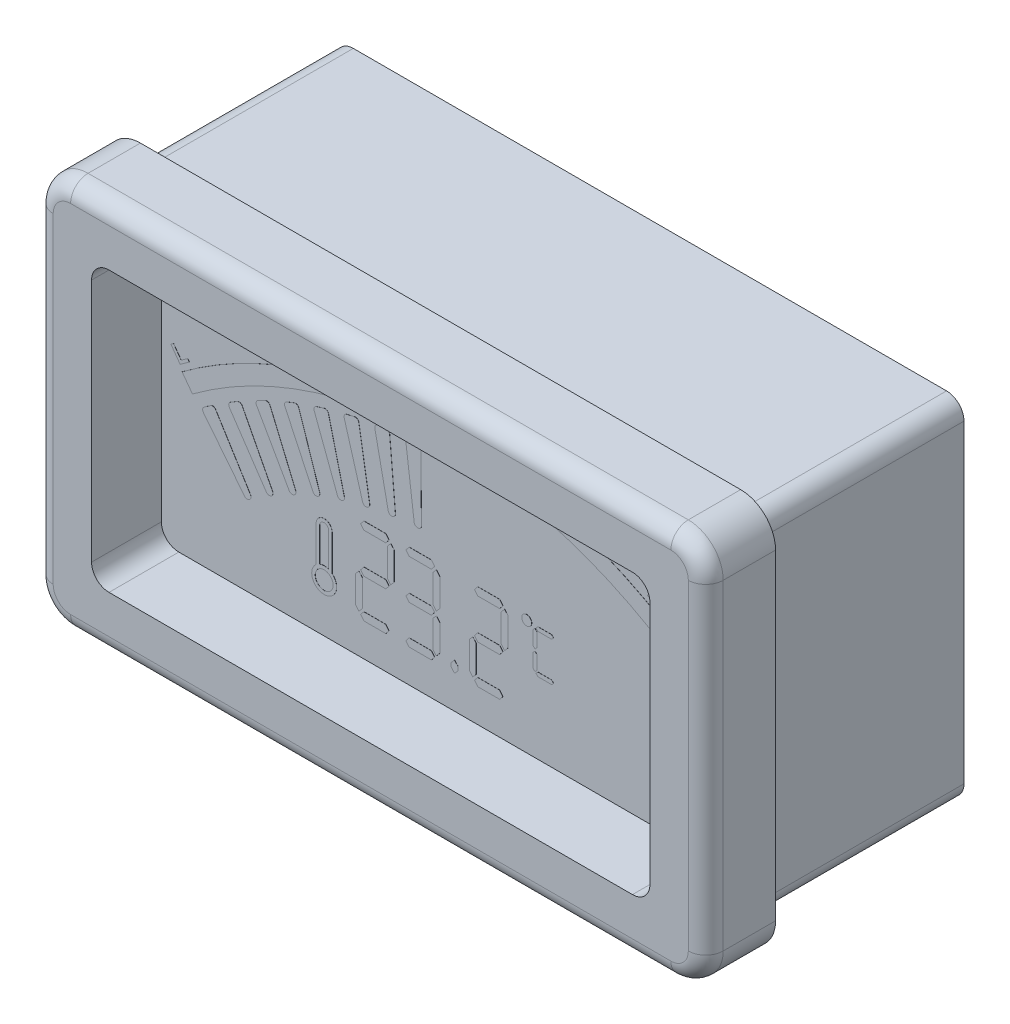
from build123d import *

# Parameters (mm, degrees)
BEZZLE_DEPTH           = 5
FILLET_2_R             = 1.25
BODY_DEPTH             = 15
BOSS_EXTRUDE1_DEPTH    = 0.01
BOSS_EXTRUDE2_DEPTH    = 0.01
BOSS_EXTRUDE3_DEPTH    = 0.01
BOSS_EXTRUDE4_DEPTH    = 0.01
SKETCH2_6_R            = 0.641120571
BOSS_EXTRUDE5_DEPTH    = 0.01
FILLET1_R              = 0.25
CIRPATTERN1_COUNT      = 8
CIRPATTERN1_ANGLE      = 31.25
BOSS_EXTRUDE6_DEPTH    = 0.01
BOSS_EXTRUDE6_2_DEPTH  = 0.01
BOSS_EXTRUDE6_3_DEPTH  = 0.01
BOSS_EXTRUDE6_4_DEPTH  = 0.01
BOSS_EXTRUDE6_5_DEPTH  = 0.01
BOSS_EXTRUDE6_6_DEPTH  = 0.01
BOSS_EXTRUDE6_7_DEPTH  = 0.01
BOSS_EXTRUDE6_8_DEPTH  = 0.01
BOSS_EXTRUDE6_9_DEPTH  = 0.01
BOSS_EXTRUDE6_10_DEPTH = 0.01
BOSS_EXTRUDE6_11_DEPTH = 0.01
BOSS_EXTRUDE6_12_DEPTH = 0.01
SKETCH4_R              = 0.355400345
BOSS_EXTRUDE7_DEPTH    = 0.01
BOSS_EXTRUDE7_2_DEPTH  = 0.01
BOSS_EXTRUDE7_3_DEPTH  = 0.01
BOSS_EXTRUDE7_4_DEPTH  = 0.01
BOSS_EXTRUDE7_5_DEPTH  = 0.01
BOSS_EXTRUDE7_6_DEPTH  = 0.01
BOSS_EXTRUDE7_7_DEPTH  = 0.01
BOSS_EXTRUDE7_8_DEPTH  = 0.01
BOSS_EXTRUDE7_9_DEPTH  = 0.01
BOSS_EXTRUDE7_10_DEPTH = 0.01
BOSS_EXTRUDE7_11_DEPTH = 0.01
BOSS_EXTRUDE7_12_DEPTH = 0.01
BOSS_EXTRUDE7_13_DEPTH = 0.01
BOSS_EXTRUDE7_14_DEPTH = 0.01
BOSS_EXTRUDE7_15_DEPTH = 0.01
BOSS_EXTRUDE7_16_DEPTH = 0.01
BOSS_EXTRUDE7_17_DEPTH = 0.01
BOSS_EXTRUDE7_18_DEPTH = 0.01
BOSS_EXTRUDE7_19_DEPTH = 0.01
BOSS_EXTRUDE7_20_DEPTH = 0.01
BOSS_EXTRUDE7_21_DEPTH = 0.01


with BuildPart() as part:
    # Esquisse1 → Bezzle (new body)
    with BuildSketch(Plane.XY):
        with BuildLine():
            Line((21.5, 14), (-21.5, 14))
            ThreePointArc((-21.5, 14), (-23.267766953, 13.267766953), (-24, 11.5))
            Line((-24, 11.5), (-24, -11.5))
            ThreePointArc((-24, -11.5), (-23.267766953, -13.267766953), (-21.5, -14))
            Line((-21.5, -14), (21.5, -14))
            ThreePointArc((21.5, -14), (23.267766953, -13.267766953), (24, -11.5))
            Line((24, -11.5), (24, 11.5))
            ThreePointArc((24, 11.5), (23.267766953, 13.267766953), (21.5, 14))
        make_face()
        with BuildLine():
            Line((18.75, -10), (-18.75, -10))
            ThreePointArc((-18.75, -10), (-19.633883476, -9.633883476), (-20, -8.75))
            Line((-20, -8.75), (-20, 8.75))
            ThreePointArc((-20, 8.75), (-19.633883476, 9.633883476), (-18.75, 10))
            Line((-18.75, 10), (18.75, 10))
            ThreePointArc((18.75, 10), (19.633883476, 9.633883476), (20, 8.75))
            Line((20, 8.75), (20, -8.75))
            ThreePointArc((20, -8.75), (19.633883476, -9.633883476), (18.75, -10))
        make_face(mode=Mode.SUBTRACT)
    extrude(amount=BEZZLE_DEPTH)

    # Fillet 2
    fillet_2_edges = [part.edges().sort_by_distance(p)[0] for p in [
        (23.267766953, 13.267766953, 5),
        (24, 0, 5),
        (23.267766953, -13.267766953, 5),
        (0, -14, 5),
        (-23.267766953, -13.267766953, 5),
        (-24, 0, 5),
        (-23.267766953, 13.267766953, 5),
        (0, 14, 5),
    ]]
    fillet(fillet_2_edges, radius=FILLET_2_R)


with BuildPart() as body_2:
    # Esquisse2 → Body (new body)
    with BuildSketch(Plane(origin=(0, 0, 0), x_dir=(-1, 0, 0), z_dir=(0, 0, -1))):
        with BuildLine():
            Line((21.25, -12.5), (-21.25, -12.5))
            ThreePointArc((-21.25, -12.5), (-22.133883476, -12.133883476), (-22.5, -11.25))
            Line((-22.5, -11.25), (-22.5, 11.25))
            ThreePointArc((-22.5, 11.25), (-22.133883476, 12.133883476), (-21.25, 12.5))
            Line((-21.25, 12.5), (21.25, 12.5))
            ThreePointArc((21.25, 12.5), (22.133883476, 12.133883476), (22.5, 11.25))
            Line((22.5, 11.25), (22.5, -11.25))
            ThreePointArc((22.5, -11.25), (22.133883476, -12.133883476), (21.25, -12.5))
        make_face()
    extrude(amount=BODY_DEPTH)


with BuildPart() as body_3:
    # Sketch2 → Boss-Extrude1 (new body)
    with BuildSketch(Plane.XY):
        with BuildLine():
            Line((-18.506258699, 1.310576078), (-17.762061153, 0.306250427))
            ThreePointArc((-17.762061153, 0.306250427), (-12.051517019, 3.627428188), (-5.750089861, 5.610494445))
            Line((-5.750089861, 5.610494445), (-5.991008002, 6.83705812))
            ThreePointArc((-5.991008002, 6.83705812), (-12.556453317, 4.770905051), (-18.506258699, 1.310576078))
        make_face()
    extrude(amount=BOSS_EXTRUDE1_DEPTH)


with BuildPart() as body_4:
    # Sketch2<3> → Boss-Extrude2 (new body)
    with BuildSketch(Plane.XY):
        with BuildLine():
            Line((-5.991008002, 6.83705812), (-5.750089861, 5.610494445))
            ThreePointArc((-5.750089861, 5.610494445), (0, 6.169858606), (5.750089861, 5.610494445))
            Line((5.750089861, 5.610494445), (5.991008002, 6.83705812))
            ThreePointArc((5.991008002, 6.83705812), (0, 7.419858606), (-5.991008002, 6.83705812))
        make_face()
    extrude(amount=BOSS_EXTRUDE2_DEPTH)


with BuildPart() as body_5:
    # Sketch2<4> → Boss-Extrude3 (new body)
    with BuildSketch(Plane.XY):
        with BuildLine():
            Line((5.991008002, 6.83705812), (5.750089861, 5.610494445))
            ThreePointArc((5.750089861, 5.610494445), (12.051517019, 3.627428188), (17.762061153, 0.306250427))
            Line((17.762061153, 0.306250427), (18.506258699, 1.310576078))
            ThreePointArc((18.506258699, 1.310576078), (12.556453317, 4.770905051), (5.991008002, 6.83705812))
        make_face()
    extrude(amount=BOSS_EXTRUDE3_DEPTH)


with BuildPart() as body_6:
    # Sketch2<5> → Boss-Extrude4 (new body)
    with BuildSketch(Plane.XY):
        with BuildLine():
            Line((-17.142740227, -0.247731886), (-13.884506562, -4.348778935))
            ThreePointArc((-13.884506562, -4.348778935), (-13.684539242, -4.206596232), (-13.483116031, -4.066483632))
            Line((-13.483116031, -4.066483632), (-16.240896016, 0.386529175))
            ThreePointArc((-16.240896016, 0.386529175), (-16.694830456, 0.073681829), (-17.142740227, -0.247731886))
        make_face()
    extrude(amount=BOSS_EXTRUDE4_DEPTH)

    # Fillet1
    fillet1_edges = [body_6.edges().sort_by_distance(p)[0] for p in [
        (-13.483116031, -4.066483632, 0.005),
        (-13.884506562, -4.348778935, 0.005),
        (-16.240896016, 0.386529175, 0.005),
        (-17.142740227, -0.247731886, 0.005),
    ]]
    fillet(fillet1_edges, radius=FILLET1_R)


with BuildPart() as body_7:
    # Sketch2<6> → Boss-Extrude5 (new body)
    with BuildSketch(Plane.XY):
        with BuildLine():
            Line((-8.898312174, -3.280332158), (-8.898312174, -5.840317581))
            ThreePointArc((-8.898312174, -5.840317581), (-8.327438059, -7.415688557), (-7.756563943, -5.840317581))
            Line((-7.756563943, -5.840317581), (-7.756563943, -3.280332158))
            ThreePointArc((-7.756563943, -3.280332158), (-8.327438059, -2.709458042), (-8.898312174, -3.280332158))
        make_face()
        with Locations((-8.327438059, -6.524567986)):
            Circle(SKETCH2_6_R, mode=Mode.SUBTRACT)
        with BuildLine():
            Line((-8.006563943, -3.280332158), (-8.006563943, -5.693222285))
            ThreePointArc((-8.006563943, -5.693222285), (-8.327438059, -5.633447415), (-8.648312174, -5.693222285))
            Line((-8.648312174, -5.693222285), (-8.648312174, -3.280332158))
            ThreePointArc((-8.648312174, -3.280332158), (-8.327438059, -2.959458042), (-8.006563943, -3.280332158))
        make_face(mode=Mode.SUBTRACT)
    extrude(amount=BOSS_EXTRUDE5_DEPTH)


with BuildPart() as cirpattern1_1:
    # CirPattern1: pattern copy
    add(body_6.part.rotate(Axis((0, -23.664392474, 0), (0, 0, -1)), 1 * CIRPATTERN1_ANGLE / (CIRPATTERN1_COUNT - 1)))


with BuildPart() as cirpattern1_2:
    # CirPattern1: pattern copy
    add(body_6.part.rotate(Axis((0, -23.664392474, 0), (0, 0, -1)), 2 * CIRPATTERN1_ANGLE / (CIRPATTERN1_COUNT - 1)))


with BuildPart() as cirpattern1_3:
    # CirPattern1: pattern copy
    add(body_6.part.rotate(Axis((0, -23.664392474, 0), (0, 0, -1)), 3 * CIRPATTERN1_ANGLE / (CIRPATTERN1_COUNT - 1)))


with BuildPart() as cirpattern1_4:
    # CirPattern1: pattern copy
    add(body_6.part.rotate(Axis((0, -23.664392474, 0), (0, 0, -1)), 4 * CIRPATTERN1_ANGLE / (CIRPATTERN1_COUNT - 1)))


with BuildPart() as cirpattern1_5:
    # CirPattern1: pattern copy
    add(body_6.part.rotate(Axis((0, -23.664392474, 0), (0, 0, -1)), 5 * CIRPATTERN1_ANGLE / (CIRPATTERN1_COUNT - 1)))


with BuildPart() as cirpattern1_6:
    # CirPattern1: pattern copy
    add(body_6.part.rotate(Axis((0, -23.664392474, 0), (0, 0, -1)), 6 * CIRPATTERN1_ANGLE / (CIRPATTERN1_COUNT - 1)))


with BuildPart() as cirpattern1_7:
    # CirPattern1: pattern copy
    add(body_6.part.rotate(Axis((0, -23.664392474, 0), (0, 0, -1)), 7 * CIRPATTERN1_ANGLE / (CIRPATTERN1_COUNT - 1)))


with BuildPart() as body_15:
    # Sketch3 → Boss-Extrude6 (new body)
    with BuildSketch(Plane.XY):
        Polygon((-18.644882683, 1.703835286), (-19.309265696, 2.625079277), (-19.121745664, 2.760305639), (-18.57024326, 1.995481921), (-18.103977234, 2.331820062), (-17.991096625, 2.175399789), align=None)
    extrude(amount=BOSS_EXTRUDE6_DEPTH)


with BuildPart() as body_16:
    # Sketch3 → Boss-Extrude6 2 (new body)
    with BuildSketch(Plane.XY):
        Polygon((-13.000727258, 5.341858199), (-13.089879903, 5.540205555), (-12.700326617, 5.715285683), (-12.611173973, 5.516938328), align=None)
    extrude(amount=BOSS_EXTRUDE6_2_DEPTH)


with BuildPart() as body_17:
    # Sketch3 → Boss-Extrude6 3 (new body)
    with BuildSketch(Plane.XY):
        with BuildLine():
            Line((-11.812673268, 5.745365914), (-11.733426473, 5.559458462))
            Line((-11.733426473, 5.559458462), (-12.435359566, 5.259748927))
            add(Edge.make_bspline(
                [(-12.435359566, 5.259748927), (-12.440324006, 5.278240095), (-12.450232642, 5.315147025), (-12.457341429, 5.372343615), (-12.45845386, 5.43046432), (-12.454351914, 5.480027445), (-12.44692502, 5.52172648), (-12.438556938, 5.556526706), (-12.427529755, 5.59473831), (-12.414254412, 5.63635979), (-12.397931328, 5.681389195), (-12.379118976, 5.729781908), (-12.357531706, 5.781559986), (-12.342037092, 5.817033733), (-12.333997387, 5.835440032)],
                knots=[0, 0, 0, 0, 1.150191406, 2.295692398, 3.454941042, 4.641404819, 5.279102508, 6.000395374, 6.792607283, 7.670255857, 8.62694727, 9.672250934, 10.792198503, 12, 12, 12, 12], degree=3))
            add(Edge.make_bspline(
                [(-12.333997387, 5.835440032), (-12.327502514, 5.850087581), (-12.31512203, 5.878008641), (-12.29814542, 5.918157811), (-12.283047044, 5.954247867), (-12.270443898, 5.986559275), (-12.259673631, 6.014814517), (-12.251514091, 6.039232427), (-12.244907281, 6.059551992), (-12.242154896, 6.072007461), (-12.240928477, 6.07755742)],
                knots=[0, 0, 0, 0, 1.480648476, 2.822402433, 4.028204961, 5.095579915, 6.027447733, 6.821836157, 7.475028849, 8, 8, 8, 8], degree=3))
            add(Edge.make_bspline(
                [(-12.240928477, 6.07755742), (-12.238984338, 6.090350785), (-12.235215207, 6.115153475), (-12.235170853, 6.151689707), (-12.24020475, 6.18610041), (-12.247937221, 6.207201183), (-12.2517558, 6.217621523)],
                knots=[0, 0, 0, 0, 1.088860172, 2.110989647, 3.06713705, 4, 4, 4, 4], degree=3))
            add(Edge.make_bspline(
                [(-12.2517558, 6.217621523), (-12.256618803, 6.228035939), (-12.26587681, 6.247862525), (-12.28477167, 6.273188807), (-12.306582961, 6.292726968), (-12.331296721, 6.30611755), (-12.358165412, 6.313621695), (-12.386733572, 6.314768867), (-12.416786985, 6.310443328), (-12.436246816, 6.302889533), (-12.446417259, 6.298941635)],
                knots=[0, 0, 0, 0, 1.149667937, 2.188695827, 3.142969078, 4.062499883, 4.981225085, 5.913646166, 6.909592673, 8, 8, 8, 8], degree=3))
            add(Edge.make_bspline(
                [(-12.446417259, 6.298941635), (-12.456230664, 6.294320707), (-12.475073199, 6.28544815), (-12.499101408, 6.266524814), (-12.517935671, 6.244325528), (-12.529222061, 6.222997411), (-12.534977778, 6.204397271), (-12.537766345, 6.189165022), (-12.538820796, 6.172869873), (-12.538394269, 6.155350498), (-12.535891406, 6.136826423), (-12.532256671, 6.11701259), (-12.526689103, 6.096175597), (-12.5219069, 6.0820616), (-12.519444102, 6.074792997)],
                knots=[0, 0, 0, 0, 1.462447126, 2.808016997, 4.097193864, 5.373983597, 6.037171228, 6.72327679, 7.462086357, 8.240867706, 9.088035885, 9.985836182, 10.96272073, 12, 12, 12, 12], degree=3))
            Line((-12.519444102, 6.074792997), (-12.727466938, 6.009598686))
            add(Edge.make_bspline(
                [(-12.727466938, 6.009598686), (-12.731427915, 6.023678155), (-12.739097324, 6.050939406), (-12.747014567, 6.091435823), (-12.7512811, 6.130044715), (-12.751868201, 6.166784216), (-12.74862124, 6.201606184), (-12.742025593, 6.234575068), (-12.731625402, 6.265715947), (-12.717396966, 6.294800939), (-12.700216105, 6.322076365), (-12.680458619, 6.347676018), (-12.658650192, 6.372025683), (-12.634017619, 6.394327164), (-12.607195941, 6.415210557), (-12.577831375, 6.434231929), (-12.54618397, 6.451933677), (-12.523751285, 6.461982333), (-12.512302675, 6.467110705)],
                knots=[0, 0, 0, 0, 1.240745015, 2.402381876, 3.49687047, 4.533009622, 5.514670011, 6.459052549, 7.380128017, 8.292309815, 9.199895152, 10.110889227, 11.033553691, 11.969808473, 12.926497281, 13.915096808, 14.93596136, 16, 16, 16, 16], degree=3))
            add(Edge.make_bspline(
                [(-12.512302675, 6.467110705), (-12.499624823, 6.472210333), (-12.474954544, 6.482133879), (-12.437629469, 6.493601017), (-12.40119748, 6.501072666), (-12.365771693, 6.505771431), (-12.331268421, 6.506291574), (-12.297726999, 6.503999066), (-12.265153795, 6.497591949), (-12.233742227, 6.487981825), (-12.203958029, 6.475298597), (-12.176070114, 6.460356036), (-12.150545015, 6.442676196), (-12.127237717, 6.422591784), (-12.106061432, 6.400109446), (-12.087397426, 6.374970637), (-12.070647125, 6.347577246), (-12.061654841, 6.327841154), (-12.057094342, 6.317831859)],
                knots=[0, 0, 0, 0, 1.218063362, 2.370272356, 3.475363685, 4.530926038, 5.55126291, 6.546859534, 7.523033699, 8.504093555, 9.470519247, 10.404886141, 11.320272581, 12.232940984, 13.143552668, 14.067831634, 15.020087527, 16, 16, 16, 16], degree=3))
            add(Edge.make_bspline(
                [(-12.057094342, 6.317831859), (-12.052396233, 6.306013331), (-12.0431119, 6.282657733), (-12.033523157, 6.246318172), (-12.027247353, 6.209619881), (-12.024473514, 6.172056199), (-12.025228594, 6.133197685), (-12.029655334, 6.092350209), (-12.036851427, 6.049121119), (-12.044282632, 6.019841166), (-12.048109967, 6.004760946)],
                knots=[0, 0, 0, 0, 0.954589557, 1.886445641, 2.816693688, 3.747924754, 4.711343575, 5.731814792, 6.831803686, 8, 8, 8, 8], degree=3))
            add(Edge.make_bspline(
                [(-12.048109967, 6.004760946), (-12.049688679, 5.999221919), (-12.053038051, 5.987470396), (-12.059129944, 5.968884394), (-12.066511869, 5.948331797), (-12.074969037, 5.925585632), (-12.085317824, 5.901111591), (-12.096236208, 5.874266951), (-12.108718937, 5.84548375), (-12.122261016, 5.815573553), (-12.135411629, 5.785872975), (-12.147996561, 5.758361056), (-12.158739531, 5.733299626), (-12.168470105, 5.71119603), (-12.176503815, 5.691614275), (-12.183474708, 5.675035672), (-12.188777677, 5.660998488), (-12.196519106, 5.640282831), (-12.204569478, 5.612195126), (-12.208446837, 5.587377986), (-12.210289454, 5.575584263)],
                knots=[0, 0, 0, 0, 0.676156102, 1.43452344, 2.295672528, 3.240056044, 4.283081471, 5.41486616, 6.642453172, 7.966092906, 9.269592181, 10.455933063, 11.517801962, 12.470753044, 13.291155781, 14.002688497, 14.581994661, 15.052613124, 16.599328314, 18, 18, 18, 18], degree=3))
            Line((-12.210289454, 5.575584263), (-11.812673268, 5.745365914))
        make_face()
    extrude(amount=BOSS_EXTRUDE6_3_DEPTH)


with BuildPart() as body_18:
    # Sketch3 → Boss-Extrude6 4 (new body)
    with BuildSketch(Plane.XY):
        with BuildLine():
            add(Edge.make_bspline(
                [(-11.656960123, 6.810373718), (-11.644291815, 6.814853104), (-11.619515005, 6.823613933), (-11.581745099, 6.832178932), (-11.544735972, 6.836351918), (-11.508545997, 6.836489978), (-11.47309338, 6.832049256), (-11.438490341, 6.823176268), (-11.404527341, 6.810348604), (-11.383229918, 6.798586259), (-11.372454915, 6.792635337)],
                knots=[0, 0, 0, 0, 1.090027835, 2.131887928, 3.135492782, 4.107873515, 5.062694656, 6.027212127, 7.00190758, 8, 8, 8, 8], degree=3))
            add(Edge.make_bspline(
                [(-11.372454915, 6.792635337), (-11.359527348, 6.784299371), (-11.332819361, 6.767077501), (-11.296369093, 6.733463614), (-11.260470568, 6.694244479), (-11.226173674, 6.647932585), (-11.193166412, 6.595041866), (-11.161255578, 6.535643066), (-11.130216138, 6.469786268), (-11.111647321, 6.423004648), (-11.10200219, 6.398705049)],
                knots=[0, 0, 0, 0, 0.758297061, 1.566620189, 2.438933269, 3.381567521, 4.407288532, 5.515173302, 6.709315904, 8, 8, 8, 8], degree=3))
            add(Edge.make_bspline(
                [(-11.10200219, 6.398705049), (-11.093014669, 6.374290675), (-11.075651311, 6.327123554), (-11.054321653, 6.257590393), (-11.038582323, 6.191941754), (-11.027652029, 6.130430041), (-11.022419546, 6.072838318), (-11.022550951, 6.019321287), (-11.027510485, 5.969625392), (-11.035796605, 5.938657143), (-11.039802671, 5.923685017)],
                knots=[0, 0, 0, 0, 1.281177608, 2.475159164, 3.579602253, 4.604268824, 5.549651486, 6.423298096, 7.237716651, 8, 8, 8, 8], degree=3))
            add(Edge.make_bspline(
                [(-11.039802671, 5.923685017), (-11.043814425, 5.912123213), (-11.051715164, 5.889353419), (-11.068480151, 5.857525191), (-11.088248302, 5.828165997), (-11.111564496, 5.801347894), (-11.138420218, 5.777279303), (-11.168953835, 5.756202446), (-11.202446122, 5.73689757), (-11.226803549, 5.726974086), (-11.23930187, 5.721882132)],
                knots=[0, 0, 0, 0, 0.996976946, 1.963444365, 2.924110179, 3.878630945, 4.854429795, 5.857056937, 6.900409744, 8, 8, 8, 8], degree=3))
            add(Edge.make_bspline(
                [(-11.23930187, 5.721882132), (-11.252118365, 5.717374895), (-11.277249996, 5.708536737), (-11.315768024, 5.700325687), (-11.353763199, 5.696229232), (-11.391389622, 5.696880512), (-11.428518817, 5.702417502), (-11.465325439, 5.711729083), (-11.501520851, 5.726065996), (-11.537358529, 5.744878403), (-11.572954917, 5.769231003), (-11.606994397, 5.801181761), (-11.64050927, 5.839727016), (-11.672987108, 5.885368181), (-11.705078845, 5.937702947), (-11.736231845, 5.997020207), (-11.766695451, 6.063333771), (-11.785276166, 6.110417245), (-11.794950908, 6.134933013)],
                knots=[0, 0, 0, 0, 0.830645133, 1.628796799, 2.403547774, 3.164902297, 3.92445665, 4.69602342, 5.483101973, 6.300726448, 7.168805436, 8.113275388, 9.148967545, 10.290068512, 11.536804623, 12.903090021, 14.387478251, 16, 16, 16, 16], degree=3))
            add(Edge.make_bspline(
                [(-11.794950908, 6.134933013), (-11.803967498, 6.159261856), (-11.821377141, 6.206237099), (-11.842307936, 6.275632972), (-11.858241561, 6.340971158), (-11.868762136, 6.40231219), (-11.874097455, 6.45972084), (-11.873935471, 6.513165798), (-11.86898321, 6.562860632), (-11.860696191, 6.593829012), (-11.85668969, 6.608801202)],
                knots=[0, 0, 0, 0, 1.280832935, 2.473090881, 3.576627212, 4.599497619, 5.543483322, 6.419329127, 7.235797786, 8, 8, 8, 8], degree=3))
            add(Edge.make_bspline(
                [(-11.85668969, 6.608801202), (-11.852675334, 6.620361393), (-11.844769468, 6.643128009), (-11.828071582, 6.674923039), (-11.808179604, 6.704190197), (-11.784707578, 6.730855443), (-11.757771845, 6.754945428), (-11.727449281, 6.776355591), (-11.693735845, 6.795295567), (-11.66944312, 6.805255654), (-11.656960123, 6.810373718)],
                knots=[0, 0, 0, 0, 0.997041047, 1.963570605, 2.91911814, 3.87782208, 4.853683669, 5.859988238, 6.900339045, 8, 8, 8, 8], degree=3))
        make_face()
        with BuildLine():
            add(Edge.make_bspline(
                [(-11.591996181, 6.641052805), (-11.5979379, 6.638409317), (-11.609575073, 6.633231906), (-11.625248452, 6.622022372), (-11.638524661, 6.608112554), (-11.649974449, 6.591663669), (-11.658496062, 6.571693697), (-11.662992868, 6.547818407), (-11.664286974, 6.520074008), (-11.66251576, 6.500441686), (-11.661567495, 6.48993101)],
                knots=[0, 0, 0, 0, 0.860495846, 1.685326944, 2.534853662, 3.398894986, 4.329237579, 5.389375671, 6.602334199, 8, 8, 8, 8], degree=3))
            add(Edge.make_bspline(
                [(-11.661567495, 6.48993101), (-11.660597101, 6.482081429), (-11.658521334, 6.465290395), (-11.652892907, 6.43875919), (-11.645870444, 6.409053838), (-11.63638933, 6.376264924), (-11.625534699, 6.340230631), (-11.612153902, 6.301241562), (-11.597278301, 6.259016094), (-11.586225788, 6.229974474), (-11.580477751, 6.214870914)],
                knots=[0, 0, 0, 0, 0.660187487, 1.412206579, 2.262943664, 3.208927498, 4.26165971, 5.405317759, 6.650593864, 8, 8, 8, 8], degree=3))
            add(Edge.make_bspline(
                [(-11.580477751, 6.214870914), (-11.574701858, 6.199873111), (-11.563616458, 6.171088531), (-11.546742978, 6.130129931), (-11.530879821, 6.092910934), (-11.515800702, 6.059624484), (-11.501408093, 6.030257301), (-11.488276891, 6.004654208), (-11.475555184, 5.983057567), (-11.460221422, 5.960271695), (-11.44173028, 5.937401539), (-11.420420289, 5.915150979), (-11.400104941, 5.898854494), (-11.380090356, 5.888769695), (-11.3605251, 5.884549404), (-11.341568199, 5.883305732), (-11.322531968, 5.885257363), (-11.310427031, 5.889350217), (-11.304265812, 5.891433414)],
                knots=[0, 0, 0, 0, 1.650286209, 3.167317019, 4.548525036, 5.804762156, 6.919156524, 7.906707492, 8.758682984, 9.49133564, 10.725275279, 11.7735731, 12.650507276, 13.387559779, 14.051283264, 14.691206855, 15.333845285, 16, 16, 16, 16], degree=3))
            add(Edge.make_bspline(
                [(-11.304265812, 5.891433414), (-11.298324569, 5.894077412), (-11.286688327, 5.899255823), (-11.271097158, 5.910394412), (-11.257901756, 5.924230511), (-11.246522301, 5.940593051), (-11.237980639, 5.960561097), (-11.233569224, 5.984445501), (-11.231881551, 6.012172551), (-11.233713777, 6.031812381), (-11.234694498, 6.04232484)],
                knots=[0, 0, 0, 0, 0.861987015, 1.688247479, 2.524826827, 3.390365464, 4.322320265, 5.38429549, 6.599912158, 8, 8, 8, 8], degree=3))
            add(Edge.make_bspline(
                [(-11.234694498, 6.04232484), (-11.235664613, 6.050097879), (-11.237741192, 6.066736462), (-11.243399329, 6.093106663), (-11.250396589, 6.122739265), (-11.259790543, 6.155402009), (-11.270825705, 6.19122696), (-11.284092661, 6.23009757), (-11.298988075, 6.272316931), (-11.310037704, 6.30135944), (-11.315784241, 6.316463462)],
                knots=[0, 0, 0, 0, 0.655876439, 1.403936804, 2.257329687, 3.206266657, 4.249989504, 5.39721778, 6.64638134, 8, 8, 8, 8], degree=3))
            add(Edge.make_bspline(
                [(-11.315784241, 6.316463462), (-11.321560131, 6.331461267), (-11.332645525, 6.360245853), (-11.34951905, 6.401204419), (-11.365382056, 6.438423529), (-11.380461661, 6.471709612), (-11.394852742, 6.501077949), (-11.407988678, 6.526677467), (-11.420696103, 6.548284895), (-11.436091041, 6.571039915), (-11.454308145, 6.594201493), (-11.47556277, 6.616702012), (-11.496118249, 6.632925629), (-11.516240009, 6.642897059), (-11.535676907, 6.6477639), (-11.554692041, 6.649225519), (-11.57372912, 6.647217239), (-11.585834657, 6.643132084), (-11.591996181, 6.641052805)],
                knots=[0, 0, 0, 0, 1.6484902, 3.163870023, 4.543574869, 5.798444824, 6.911626395, 7.898102609, 8.749150895, 9.481006203, 10.714860671, 11.767660648, 12.649886317, 13.386136685, 14.052870457, 14.692631217, 15.334570263, 16, 16, 16, 16], degree=3))
        make_face(mode=Mode.SUBTRACT)
    extrude(amount=BOSS_EXTRUDE6_4_DEPTH)


with BuildPart() as body_19:
    # Sketch3 → Boss-Extrude6 5 (new body)
    with BuildSketch(Plane.XY):
        with BuildLine():
            Line((-2.29884747, 7.93879822), (-2.281800194, 7.735843492))
            Line((-2.281800194, 7.735843492), (-3.047775755, 7.671340287))
            add(Edge.make_bspline(
                [(-3.047775755, 7.671340287), (-3.046674357, 7.690584787), (-3.044473095, 7.729046997), (-3.033336765, 7.786027679), (-3.015844451, 7.84186409), (-2.996160748, 7.8878466), (-2.976052378, 7.925356066), (-2.956900595, 7.955914847), (-2.934652965, 7.989224685), (-2.908113409, 8.024436682), (-2.878777483, 8.062687906), (-2.845138132, 8.102783498), (-2.808413734, 8.145749792), (-2.782161478, 8.174686994), (-2.768569024, 8.189669614)],
                knots=[0, 0, 0, 0, 1.149751928, 2.297903325, 3.454998259, 4.637843393, 5.277768322, 5.994059165, 6.790010412, 7.668391236, 8.62573274, 9.667603828, 10.792371021, 12, 12, 12, 12], degree=3))
            add(Edge.make_bspline(
                [(-2.768569024, 8.189669614), (-2.757705176, 8.201616203), (-2.7369946, 8.224390887), (-2.708058992, 8.25734015), (-2.682259474, 8.287089085), (-2.660170142, 8.314026718), (-2.640733058, 8.337449552), (-2.625194027, 8.358142446), (-2.612723459, 8.375633376), (-2.60610518, 8.386599673), (-2.603164377, 8.391472498)],
                knots=[0, 0, 0, 0, 1.483333624, 2.827790932, 4.028280746, 5.100371111, 6.028010915, 6.823723148, 7.477326626, 8, 8, 8, 8], degree=3))
            add(Edge.make_bspline(
                [(-2.603164377, 8.391472498), (-2.597223726, 8.403156696), (-2.585749373, 8.425724697), (-2.574502187, 8.460887146), (-2.568080493, 8.495367803), (-2.568898336, 8.518075272), (-2.569300194, 8.529232915)],
                knots=[0, 0, 0, 0, 1.091994544, 2.109185012, 3.070920708, 4, 4, 4, 4], degree=3))
            add(Edge.make_bspline(
                [(-2.569300194, 8.529232915), (-2.570666726, 8.540677475), (-2.573273894, 8.562512233), (-2.583282942, 8.592612785), (-2.5976539, 8.618409194), (-2.617224121, 8.638948816), (-2.640578205, 8.654650469), (-2.667510218, 8.664873558), (-2.697680324, 8.6697286), (-2.718644002, 8.668840983), (-2.729636733, 8.668375543)],
                knots=[0, 0, 0, 0, 1.144933618, 2.184387163, 3.136338012, 4.061043246, 4.981187324, 5.915292159, 6.906841124, 8, 8, 8, 8], degree=3))
            add(Edge.make_bspline(
                [(-2.729636733, 8.668375543), (-2.740467747, 8.667009866), (-2.761271425, 8.664386741), (-2.79030876, 8.65409816), (-2.815147078, 8.638554496), (-2.832736075, 8.621899526), (-2.844064486, 8.605891251), (-2.851443829, 8.59218518), (-2.857627514, 8.576877231), (-2.86273545, 8.560009375), (-2.866278803, 8.54154442), (-2.868823165, 8.521541119), (-2.870188466, 8.499918753), (-2.870170743, 8.484927097), (-2.870161573, 8.477169614)],
                knots=[0, 0, 0, 0, 1.463762715, 2.811523223, 4.099803903, 5.376673178, 6.035114056, 6.727593647, 7.463300936, 8.249911441, 9.09162871, 9.986131821, 10.95791717, 12, 12, 12, 12], degree=3))
            Line((-2.870161573, 8.477169614), (-3.089702839, 8.480625143))
            add(Edge.make_bspline(
                [(-3.089702839, 8.480625143), (-3.089073034, 8.495307866), (-3.087852391, 8.523764897), (-3.082541817, 8.564996228), (-3.074361356, 8.603248411), (-3.063231667, 8.638564736), (-3.049584036, 8.671004673), (-3.032543447, 8.700344687), (-3.012716234, 8.726777511), (-2.989866786, 8.750089747), (-2.964954886, 8.770858724), (-2.937970436, 8.789052174), (-2.909436445, 8.805355222), (-2.878819265, 8.81875344), (-2.84667669, 8.830541275), (-2.812531552, 8.839287597), (-2.776680286, 8.846136615), (-2.752085228, 8.848632947), (-2.739542582, 8.849905992)],
                knots=[0, 0, 0, 0, 1.238297305, 2.399981567, 3.499393587, 4.531103872, 5.516966745, 6.459489096, 7.383766702, 8.294644135, 9.204578238, 10.112968692, 11.034613669, 11.970445053, 12.926559419, 13.917191343, 14.937838156, 16, 16, 16, 16], degree=3))
            add(Edge.make_bspline(
                [(-2.739542582, 8.849905992), (-2.725802986, 8.85084046), (-2.699025437, 8.852661675), (-2.659741361, 8.851268582), (-2.622407883, 8.847592381), (-2.587145867, 8.84045278), (-2.553903807, 8.830234869), (-2.522600782, 8.817175017), (-2.493508321, 8.800668992), (-2.466569034, 8.781514916), (-2.441938969, 8.760228102), (-2.420258482, 8.736895492), (-2.401401823, 8.711938152), (-2.385128418, 8.685528058), (-2.372279036, 8.657117328), (-2.362054597, 8.627293431), (-2.354856638, 8.595770617), (-2.352393437, 8.574109609), (-2.35114114, 8.563097098)],
                knots=[0, 0, 0, 0, 1.217987108, 2.373774856, 3.473983147, 4.534870244, 5.551633754, 6.54749281, 7.530351543, 8.505213189, 9.468637994, 10.406287777, 11.31829496, 12.233209249, 13.145469592, 14.071721666, 15.019658376, 16, 16, 16, 16], degree=3))
            add(Edge.make_bspline(
                [(-2.35114114, 8.563097098), (-2.350433134, 8.550352447), (-2.349029312, 8.525082588), (-2.351284851, 8.487357), (-2.356744383, 8.450233512), (-2.366102337, 8.413524876), (-2.379363958, 8.376621268), (-2.396157565, 8.338813431), (-2.417374454, 8.30005266), (-2.433548982, 8.274359524), (-2.441906364, 8.261083877)],
                knots=[0, 0, 0, 0, 0.951498299, 1.886613317, 2.813374993, 3.746979976, 4.707197407, 5.735480957, 6.829922581, 8, 8, 8, 8], degree=3))
            add(Edge.make_bspline(
                [(-2.441906364, 8.261083877), (-2.445181408, 8.256303897), (-2.452120054, 8.246176829), (-2.463815294, 8.230364983), (-2.477298225, 8.21297688), (-2.492839871, 8.194090676), (-2.510045356, 8.17359952), (-2.529328796, 8.151631053), (-2.550395232, 8.128079067), (-2.572608592, 8.103530248), (-2.594936244, 8.079683647), (-2.615415967, 8.057015149), (-2.633797629, 8.036614783), (-2.649930791, 8.018421116), (-2.663835217, 8.00245192), (-2.675590865, 7.988634637), (-2.685244389, 7.977001929), (-2.698942775, 7.959442931), (-2.715713277, 7.935357994), (-2.727320954, 7.912893207), (-2.732861893, 7.902169614)],
                knots=[0, 0, 0, 0, 0.675513474, 1.431171639, 2.292559121, 3.240594042, 4.282597019, 5.412010847, 6.648450511, 7.966746996, 9.271844296, 10.457046465, 11.528442652, 12.473428949, 13.292068147, 13.997076544, 14.588577633, 15.054214178, 16.59382557, 18, 18, 18, 18], degree=3))
            Line((-2.732861893, 7.902169614), (-2.29884747, 7.93879822))
        make_face()
    extrude(amount=BOSS_EXTRUDE6_5_DEPTH)


with BuildPart() as body_20:
    # Sketch3 → Boss-Extrude6 6 (new body)
    with BuildSketch(Plane.XY):
        with BuildLine():
            add(Edge.make_bspline(
                [(-1.835119976, 8.911223449), (-1.821679113, 8.911657225), (-1.795361033, 8.912506587), (-1.756782946, 8.909023342), (-1.720334053, 8.901474001), (-1.685723404, 8.890932191), (-1.653471466, 8.875587645), (-1.623071884, 8.856896651), (-1.594725193, 8.834219792), (-1.577982645, 8.816519961), (-1.569504992, 8.807557583)],
                knots=[0, 0, 0, 0, 1.090739706, 2.13573909, 3.134342454, 4.108072573, 5.064414694, 6.02432436, 6.999608973, 8, 8, 8, 8], degree=3))
            add(Edge.make_bspline(
                [(-1.569504992, 8.807557583), (-1.564580974, 8.801790187), (-1.554618062, 8.790120842), (-1.541027597, 8.771021907), (-1.528186042, 8.750519668), (-1.515929262, 8.728657544), (-1.504666855, 8.705223846), (-1.494004016, 8.680365827), (-1.484475417, 8.653836631), (-1.475411509, 8.625988723), (-1.46740605, 8.596591588), (-1.460051487, 8.565703269), (-1.453339387, 8.533299891), (-1.447693804, 8.49938816), (-1.442516498, 8.464077099), (-1.438507042, 8.427256853), (-1.434983687, 8.388936283), (-1.433296163, 8.36287413), (-1.432435681, 8.349584827)],
                knots=[0, 0, 0, 0, 0.748166435, 1.513787376, 2.310727978, 3.135194607, 3.985993736, 4.875669802, 5.80355368, 6.767060627, 7.765466427, 8.80959842, 9.900594358, 11.030692341, 12.202193278, 13.42246994, 14.685696465, 16, 16, 16, 16], degree=3))
            add(Edge.make_bspline(
                [(-1.432435681, 8.349584827), (-1.431333907, 8.323559178), (-1.42920877, 8.273360079), (-1.43028619, 8.200594936), (-1.43527263, 8.133359468), (-1.443717402, 8.071450604), (-1.456662779, 8.015153786), (-1.472852782, 7.964147656), (-1.492772007, 7.918364853), (-1.510172075, 7.891488801), (-1.518593533, 7.878481061)],
                knots=[0, 0, 0, 0, 1.283175742, 2.475030094, 3.58285195, 4.603142066, 5.550239601, 6.424810893, 7.237624245, 8, 8, 8, 8], degree=3))
            add(Edge.make_bspline(
                [(-1.518593533, 7.878481061), (-1.525865371, 7.868667011), (-1.540226907, 7.849284725), (-1.565975471, 7.824228515), (-1.593764274, 7.802298289), (-1.624144244, 7.783954041), (-1.657108209, 7.769477345), (-1.692478521, 7.758361853), (-1.730326445, 7.750705714), (-1.756530884, 7.748519069), (-1.769925665, 7.747401333)],
                knots=[0, 0, 0, 0, 0.995786619, 1.96663165, 2.922277441, 3.881330766, 4.855247715, 5.854560648, 6.90332743, 8, 8, 8, 8], degree=3))
            add(Edge.make_bspline(
                [(-1.769925665, 7.747401333), (-1.783526907, 7.747006769), (-1.810103522, 7.746235795), (-1.849238927, 7.750477722), (-1.886691456, 7.757981462), (-1.922208685, 7.770548434), (-1.956086011, 7.786536672), (-1.98781822, 7.807288334), (-2.018254155, 7.831394444), (-2.041483182, 7.855275032), (-2.05915488, 7.876364926), (-2.071652935, 7.894161113), (-2.083641096, 7.913391334), (-2.094637819, 7.934483057), (-2.104970776, 7.957030928), (-2.114655305, 7.981195078), (-2.123928205, 8.006875356), (-2.13207214, 8.034309458), (-2.139770939, 8.063252361), (-2.146550737, 8.09378458), (-2.152919748, 8.125935563), (-2.157983398, 8.159722719), (-2.162943159, 8.195101234), (-2.167086342, 8.232044683), (-2.170218017, 8.270700357), (-2.17195303, 8.296981702), (-2.172840328, 8.310422167)],
                knots=[0, 0, 0, 0, 1.247815368, 2.438211726, 3.605143362, 4.746627582, 5.888068262, 7.035956401, 8.219507073, 9.445829285, 10.086692415, 10.743941502, 11.440399678, 12.165696148, 12.925919696, 13.716617355, 14.555026982, 15.431488264, 16.342891007, 17.304056446, 18.302278869, 19.351191521, 20.439906816, 21.58197865, 22.763406887, 24, 24, 24, 24], degree=3))
            add(Edge.make_bspline(
                [(-2.172840328, 8.310422167), (-2.173941862, 8.336371133), (-2.176066303, 8.386416834), (-2.174993911, 8.458873709), (-2.170003339, 8.52588484), (-2.161475553, 8.587518775), (-2.148992359, 8.643788184), (-2.132312721, 8.694498147), (-2.112496682, 8.740202069), (-2.095249294, 8.767128801), (-2.086912844, 8.780143721)],
                knots=[0, 0, 0, 0, 1.283248761, 2.474899502, 3.578491127, 4.601854895, 5.547262632, 6.422035878, 7.237297853, 8, 8, 8, 8], degree=3))
            add(Edge.make_bspline(
                [(-2.086912844, 8.780143721), (-2.079552771, 8.789948866), (-2.065044826, 8.809276459), (-2.039310424, 8.834403789), (-2.01150951, 8.856325819), (-1.981130803, 8.874665885), (-1.948106875, 8.889197701), (-1.912630489, 8.900220701), (-1.8747215, 8.907926483), (-1.848515536, 8.910108221), (-1.835119976, 8.911223449)],
                knots=[0, 0, 0, 0, 0.998436241, 1.968086148, 2.922555525, 3.880428241, 4.853146284, 5.857201716, 6.904677451, 8, 8, 8, 8], degree=3))
        make_face()
        with BuildLine():
            add(Edge.make_bspline(
                [(-1.824983758, 8.730153737), (-1.83139806, 8.72945161), (-1.844077175, 8.72806372), (-1.862370054, 8.722128001), (-1.879300238, 8.712995434), (-1.895157857, 8.700823331), (-1.909352257, 8.684470606), (-1.920956396, 8.663115763), (-1.930848106, 8.637156207), (-1.935272811, 8.617882707), (-1.937633998, 8.607597648)],
                knots=[0, 0, 0, 0, 0.854132538, 1.688358792, 2.531305742, 3.395099353, 4.326387487, 5.37996657, 6.601852377, 8, 8, 8, 8], degree=3))
            add(Edge.make_bspline(
                [(-1.937633998, 8.607597648), (-1.939029822, 8.5998554), (-1.942029975, 8.583214389), (-1.944827298, 8.556272556), (-1.946786582, 8.525839957), (-1.948300922, 8.49181389), (-1.948264956, 8.454170597), (-1.947985072, 8.412922566), (-1.946168095, 8.36815634), (-1.944645553, 8.337143427), (-1.94385395, 8.321019122)],
                knots=[0, 0, 0, 0, 0.657096855, 1.412348924, 2.261182797, 3.205070743, 4.257259281, 5.405734907, 6.651183781, 8, 8, 8, 8], degree=3))
            add(Edge.make_bspline(
                [(-1.94385395, 8.321019122), (-1.94291924, 8.304965568), (-1.941124893, 8.274147848), (-1.937536375, 8.229930289), (-1.934119606, 8.189641657), (-1.929546712, 8.153351521), (-1.925180521, 8.120962408), (-1.919996216, 8.09257055), (-1.914992405, 8.068012896), (-1.907166143, 8.041698667), (-1.896865874, 8.014233048), (-1.883508188, 7.986432411), (-1.868974109, 7.964799813), (-1.852913719, 7.949206151), (-1.835804846, 7.93886513), (-1.81796965, 7.93216033), (-1.799280996, 7.928206728), (-1.786530859, 7.928382078), (-1.780061883, 7.928471045)],
                knots=[0, 0, 0, 0, 1.651032651, 3.16945793, 4.554989867, 5.801878624, 6.9247126, 7.909889098, 8.765087398, 9.496132761, 10.726231778, 11.773468282, 12.657088578, 13.387623553, 14.052913345, 14.694272695, 15.337519326, 16, 16, 16, 16], degree=3))
            add(Edge.make_bspline(
                [(-1.780061883, 7.928471045), (-1.773646456, 7.929171018), (-1.760965119, 7.93055465), (-1.742788101, 7.936489375), (-1.725875718, 7.945427226), (-1.710114143, 7.957576792), (-1.695894955, 7.974021924), (-1.684050323, 7.995348291), (-1.674510161, 8.021530167), (-1.670033971, 8.040754269), (-1.667642011, 8.051027135)],
                knots=[0, 0, 0, 0, 0.854505964, 1.689096942, 2.518634473, 3.382805735, 4.314501028, 5.382436028, 6.601241107, 8, 8, 8, 8], degree=3))
            add(Edge.make_bspline(
                [(-1.667642011, 8.051027135), (-1.666266486, 8.058694831), (-1.663306506, 8.07519488), (-1.660125595, 8.101871339), (-1.658272741, 8.132249967), (-1.656751822, 8.166118986), (-1.656763285, 8.203687114), (-1.657135989, 8.24477558), (-1.658560666, 8.289552456), (-1.660140081, 8.32056088), (-1.660961322, 8.336684186)],
                knots=[0, 0, 0, 0, 0.652810804, 1.40477799, 2.249851658, 3.203128541, 4.245743707, 5.397819065, 6.646956111, 8, 8, 8, 8], degree=3))
            add(Edge.make_bspline(
                [(-1.660961322, 8.336684186), (-1.661909323, 8.35273636), (-1.663729183, 8.383551433), (-1.667143753, 8.427794287), (-1.671145142, 8.468097172), (-1.675044829, 8.504477988), (-1.67997895, 8.536790645), (-1.685028482, 8.565135376), (-1.690053715, 8.589691221), (-1.697914738, 8.616068009), (-1.708127597, 8.64364118), (-1.721536749, 8.671508632), (-1.736147187, 8.693198315), (-1.752250066, 8.708952354), (-1.769529193, 8.71911236), (-1.787021575, 8.726641124), (-1.805782498, 8.730373034), (-1.81852079, 8.73022755), (-1.824983758, 8.730153737)],
                knots=[0, 0, 0, 0, 1.649176078, 3.165893899, 4.550607089, 5.802996737, 6.917912156, 7.901980831, 8.756217467, 9.486440775, 10.722529646, 11.76858854, 12.651215213, 13.392063575, 14.056605254, 14.695740975, 15.33826428, 16, 16, 16, 16], degree=3))
        make_face(mode=Mode.SUBTRACT)
    extrude(amount=BOSS_EXTRUDE6_6_DEPTH)


with BuildPart() as body_21:
    # Sketch3 → Boss-Extrude6 7 (new body)
    with BuildSketch(Plane.XY):
        with BuildLine():
            Line((7.565884126, 7.779654108), (7.355327235, 7.804073178))
            add(Edge.make_bspline(
                [(7.355327235, 7.804073178), (7.356043219, 7.814353442), (7.357396644, 7.833786202), (7.355425099, 7.861639476), (7.34865028, 7.885979644), (7.338280695, 7.907066864), (7.323746489, 7.924407466), (7.306253577, 7.938730122), (7.285254596, 7.949523047), (7.269806474, 7.95371356), (7.261797587, 7.955886079)],
                knots=[0, 0, 0, 0, 1.245056436, 2.353527361, 3.355700399, 4.28140739, 5.171576274, 6.068926971, 6.998859155, 8, 8, 8, 8], degree=3))
            add(Edge.make_bspline(
                [(7.261797587, 7.955886079), (7.256209674, 7.956923527), (7.24525041, 7.958958215), (7.228604254, 7.95999664), (7.212289662, 7.95847822), (7.196111873, 7.955258873), (7.180178632, 7.949905871), (7.164424216, 7.942459783), (7.148946937, 7.932898956), (7.133468722, 7.921257219), (7.117995802, 7.906410168), (7.103545516, 7.886932859), (7.088778848, 7.863634478), (7.074312252, 7.835909143), (7.059857896, 7.803915198), (7.045778042, 7.76744555), (7.031364427, 7.726867408), (7.022631815, 7.698142865), (7.018067619, 7.683129669)],
                knots=[0, 0, 0, 0, 0.673003975, 1.319925172, 1.968124366, 2.608617332, 3.270274072, 3.953953086, 4.668527541, 5.421779569, 6.245259245, 7.19872464, 8.286470311, 9.511379259, 10.89969948, 12.443749834, 14.141286987, 16, 16, 16, 16], degree=3))
            add(Edge.make_bspline(
                [(7.018067619, 7.683129669), (7.026475742, 7.689069019), (7.042943688, 7.700701688), (7.069167916, 7.714787787), (7.095893329, 7.725704481), (7.123039789, 7.733690923), (7.150915286, 7.737981429), (7.179187031, 7.739487546), (7.208096085, 7.737319286), (7.227195766, 7.733620286), (7.23691778, 7.731737441)],
                knots=[0, 0, 0, 0, 1.065011575, 2.085905981, 3.073571163, 4.049843913, 5.007884068, 5.986904382, 6.975305208, 8, 8, 8, 8], degree=3))
            add(Edge.make_bspline(
                [(7.23691778, 7.731737441), (7.247738133, 7.728971791), (7.269121418, 7.723506286), (7.299648302, 7.711408251), (7.328169059, 7.696220538), (7.35496746, 7.678612939), (7.379693171, 7.657735347), (7.402459605, 7.634024562), (7.423232805, 7.607303832), (7.442021953, 7.578198831), (7.458352444, 7.547131665), (7.471311728, 7.514467785), (7.480825136, 7.480652998), (7.486735423, 7.445667567), (7.489559678, 7.409501929), (7.488769356, 7.37217958), (7.484625633, 7.333719484), (7.479398614, 7.308054421), (7.476731481, 7.294958595)],
                knots=[0, 0, 0, 0, 0.963468065, 1.904014839, 2.826300495, 3.749324485, 4.666904267, 5.61401681, 6.582126587, 7.58432035, 8.60140158, 9.607184937, 10.612531225, 11.628315267, 12.665570878, 13.739732311, 14.846678402, 16, 16, 16, 16], degree=3))
            add(Edge.make_bspline(
                [(7.476731481, 7.294958595), (7.473295785, 7.281139552), (7.466587781, 7.254158656), (7.452533662, 7.21577092), (7.436218716, 7.180122202), (7.41730143, 7.147168167), (7.395603143, 7.117137465), (7.371235383, 7.089917412), (7.344134034, 7.06567318), (7.314716471, 7.044306188), (7.283478699, 7.0261119), (7.250882678, 7.011519216), (7.217257643, 7.000683707), (7.182702759, 6.993189656), (7.147009977, 6.989520451), (7.110297105, 6.98968623), (7.072468232, 6.99298426), (7.047284628, 6.998143282), (7.034423789, 7.000777906)],
                knots=[0, 0, 0, 0, 1.14338517, 2.232394604, 3.278637648, 4.29031038, 5.280073616, 6.249985579, 7.219897541, 8.196049083, 9.166412263, 10.119219366, 11.059641381, 11.999881236, 12.95512218, 13.936097133, 14.945999921, 16, 16, 16, 16], degree=3))
            add(Edge.make_bspline(
                [(7.034423789, 7.000777906), (7.020822146, 7.004338307), (6.994106013, 7.011331592), (6.956133105, 7.026429468), (6.920920693, 7.045223211), (6.888714065, 7.067876089), (6.859038814, 7.093981153), (6.832233227, 7.123786263), (6.808564104, 7.157492934), (6.787296771, 7.194511232), (6.769805235, 7.235853165), (6.757448148, 7.281754458), (6.749036553, 7.331896076), (6.745998703, 7.386450103), (6.746868477, 7.445442272), (6.753011492, 7.508734309), (6.763062568, 7.576521468), (6.773064569, 7.622747786), (6.778253917, 7.646731432)],
                knots=[0, 0, 0, 0, 0.859139582, 1.687508357, 2.492126398, 3.294576651, 4.089698186, 4.904324721, 5.739493025, 6.603814012, 7.510806631, 8.475751158, 9.50400493, 10.614417611, 11.811959059, 13.108591468, 14.499847644, 16, 16, 16, 16], degree=3))
            add(Edge.make_bspline(
                [(6.778253917, 7.646731432), (6.784235614, 7.671136059), (6.795786097, 7.718260688), (6.816361752, 7.785459464), (6.839730849, 7.846397345), (6.8647172, 7.901512656), (6.892801546, 7.950239461), (6.922864171, 7.993028977), (6.955150059, 8.030033301), (6.990328086, 8.060274329), (7.026896619, 8.0853047), (7.064694904, 8.105504563), (7.103688267, 8.121141295), (7.143833804, 8.131903129), (7.185087572, 8.138328944), (7.227438116, 8.13947563), (7.271046073, 8.136468909), (7.300012149, 8.130535969), (7.314782363, 8.127510678)],
                knots=[0, 0, 0, 0, 1.478484739, 2.85491127, 4.132199019, 5.316987736, 6.41218961, 7.436533819, 8.390461812, 9.293793236, 10.158621975, 10.99353752, 11.810841657, 12.625292629, 13.434373108, 14.261758604, 15.113646058, 16, 16, 16, 16], degree=3))
            add(Edge.make_bspline(
                [(7.314782363, 8.127510678), (7.325047265, 8.125001783), (7.345203112, 8.120075392), (7.37403046, 8.109765644), (7.401061082, 8.097891819), (7.426190144, 8.083919186), (7.449467235, 8.068108796), (7.470776439, 8.050138914), (7.490446634, 8.030630226), (7.508022951, 8.009074077), (7.523413227, 7.985827065), (7.536668394, 7.961013108), (7.547482393, 7.93460547), (7.556102964, 7.906638946), (7.561899657, 7.876967075), (7.565921592, 7.845886999), (7.567261353, 7.813209632), (7.566350474, 7.791016472), (7.565884126, 7.779654108)],
                knots=[0, 0, 0, 0, 1.072151301, 2.105243318, 3.103388245, 4.066548522, 5.02013308, 5.955409633, 6.892536325, 7.828852003, 8.773729013, 9.718863272, 10.680160294, 11.666576163, 12.684824941, 13.745578541, 14.845790461, 16, 16, 16, 16], degree=3))
        make_face()
        with BuildLine():
            add(Edge.make_bspline(
                [(6.978444222, 7.42649906), (6.976635932, 7.418073211), (6.973120089, 7.401690898), (6.969957471, 7.377436427), (6.968351365, 7.354329777), (6.969302659, 7.332317653), (6.971029424, 7.311365724), (6.975361065, 7.291560851), (6.981216571, 7.272895526), (6.989138484, 7.255597446), (6.998344412, 7.23982118), (7.008275296, 7.225498149), (7.018775257, 7.212536368), (7.030751834, 7.201913344), (7.042910676, 7.1920977), (7.056354256, 7.184590238), (7.070557116, 7.178770273), (7.080388541, 7.176066567), (7.085335247, 7.174706191)],
                knots=[0, 0, 0, 0, 1.357920574, 2.64019445, 3.852872006, 5.00342084, 6.11035068, 7.162093913, 8.19187355, 9.188682401, 10.154127787, 11.067474364, 11.935412588, 12.774945162, 13.586070904, 14.393847676, 15.191860508, 16, 16, 16, 16], degree=3))
            add(Edge.make_bspline(
                [(7.085335247, 7.174706191), (7.094981744, 7.172999637), (7.11378765, 7.1696727), (7.14238211, 7.172843775), (7.169633509, 7.181969299), (7.190754734, 7.194959404), (7.206521911, 7.208541171), (7.217803824, 7.22113638), (7.228503917, 7.235723043), (7.238026236, 7.252583964), (7.246833639, 7.271469065), (7.254901632, 7.292463394), (7.261911715, 7.31568797), (7.265939873, 7.3319523), (7.268017539, 7.340341207)],
                knots=[0, 0, 0, 0, 1.26185334, 2.45999097, 3.675833105, 4.955435012, 5.638637489, 6.363070288, 7.138058446, 7.974777685, 8.86366241, 9.832305267, 10.881934177, 12, 12, 12, 12], degree=3))
            add(Edge.make_bspline(
                [(7.268017539, 7.340341207), (7.269868549, 7.349078207), (7.273441531, 7.365943127), (7.277250553, 7.390695492), (7.27901749, 7.414020928), (7.279530094, 7.435912251), (7.277489684, 7.456235908), (7.274437385, 7.475106741), (7.269437146, 7.492488419), (7.26234657, 7.508174522), (7.254312736, 7.522562518), (7.245063082, 7.535564209), (7.234638316, 7.547081607), (7.22337231, 7.557311438), (7.210968216, 7.56594934), (7.197557238, 7.573042395), (7.183146689, 7.578949574), (7.172989604, 7.581578161), (7.167807203, 7.582919332)],
                knots=[0, 0, 0, 0, 1.449308278, 2.7975813, 4.060198242, 5.244165795, 6.345355235, 7.369754115, 8.343795027, 9.270025298, 10.157290157, 11.014916244, 11.85322003, 12.673924591, 13.479444639, 14.299013013, 15.132113356, 16, 16, 16, 16], degree=3))
            add(Edge.make_bspline(
                [(7.167807203, 7.582919332), (7.157855506, 7.584603715), (7.138211597, 7.587928562), (7.108247166, 7.584929232), (7.079493957, 7.575095348), (7.057082459, 7.561795616), (7.040040678, 7.548348398), (7.028333297, 7.535933909), (7.017385183, 7.522023367), (7.007508396, 7.50623719), (6.998524872, 7.488759147), (6.990797115, 7.469502894), (6.983728986, 7.448708888), (6.980242982, 7.434058556), (6.978444222, 7.42649906)],
                knots=[0, 0, 0, 0, 1.312946468, 2.59165868, 3.881792382, 5.251997393, 5.972119146, 6.70940794, 7.473401484, 8.279878145, 9.136149023, 10.035236657, 10.98619229, 12, 12, 12, 12], degree=3))
        make_face(mode=Mode.SUBTRACT)
    extrude(amount=BOSS_EXTRUDE6_7_DEPTH)


with BuildPart() as body_22:
    # Sketch3 → Boss-Extrude6 8 (new body)
    with BuildSketch(Plane.XY):
        with BuildLine():
            add(Edge.make_bspline(
                [(8.162093529, 7.928630339), (8.175085334, 7.924906764), (8.200425649, 7.91764399), (8.23614058, 7.902449018), (8.268841929, 7.884454311), (8.298529471, 7.863527007), (8.324796887, 7.83924707), (8.348017724, 7.812059138), (8.368237009, 7.781851726), (8.378821629, 7.759835035), (8.38416885, 7.74871247)],
                knots=[0, 0, 0, 0, 1.093588745, 2.133027932, 3.135038443, 4.111642835, 5.066626744, 6.023713876, 7.001604251, 8, 8, 8, 8], degree=3))
            add(Edge.make_bspline(
                [(8.38416885, 7.74871247), (8.389880263, 7.73440659), (8.401701145, 7.704797787), (8.411839471, 7.656105855), (8.418108966, 7.60308075), (8.419308741, 7.545238397), (8.415302624, 7.482752158), (8.406910428, 7.415599176), (8.393715195, 7.343767613), (8.381666869, 7.294750845), (8.375414843, 7.269315435)],
                knots=[0, 0, 0, 0, 0.756759858, 1.566261727, 2.437610767, 3.382593508, 4.408443198, 5.516469247, 6.711265008, 8, 8, 8, 8], degree=3))
            add(Edge.make_bspline(
                [(8.375414843, 7.269315435), (8.368520504, 7.244131995), (8.355206813, 7.195500138), (8.331975345, 7.126415061), (8.306941071, 7.063630545), (8.279872174, 7.007258911), (8.250725437, 6.957153686), (8.219219165, 6.913679439), (8.186403378, 6.87588475), (8.161612724, 6.85550086), (8.149653625, 6.845667599)],
                knots=[0, 0, 0, 0, 1.283157504, 2.477911271, 3.58039679, 4.603378438, 5.549115328, 6.424895092, 7.240163824, 8, 8, 8, 8], degree=3))
            add(Edge.make_bspline(
                [(8.149653625, 6.845667599), (8.139680162, 6.838574669), (8.119984307, 6.824567367), (8.087906544, 6.808259709), (8.054658007, 6.795944222), (8.020124157, 6.787457795), (7.984117785, 6.783762299), (7.94688645, 6.783664337), (7.908359088, 6.788179054), (7.882685742, 6.794050226), (7.86952542, 6.797059826)],
                knots=[0, 0, 0, 0, 0.995063077, 1.9650766, 2.918291114, 3.876390743, 4.851004797, 5.85731144, 6.901644044, 8, 8, 8, 8], degree=3))
            add(Edge.make_bspline(
                [(7.86952542, 6.797059826), (7.856452713, 6.800853164), (7.830848799, 6.808282711), (7.794634198, 6.823963461), (7.761262502, 6.842756932), (7.731034189, 6.865411767), (7.703749724, 6.891314177), (7.679344679, 6.920582148), (7.658159661, 6.953285134), (7.643047257, 6.982957772), (7.632502836, 7.008450527), (7.626253683, 7.029352189), (7.620573416, 7.051359891), (7.61663382, 7.074810919), (7.613221068, 7.099450647), (7.611626878, 7.125545257), (7.610531416, 7.152894525), (7.611143186, 7.181565775), (7.612746874, 7.211530318), (7.615550166, 7.242874855), (7.619464982, 7.275525458), (7.624584194, 7.309472025), (7.630785235, 7.344657218), (7.638254079, 7.381198793), (7.64668574, 7.419086661), (7.653147266, 7.444717579), (7.656434475, 7.457756942)],
                knots=[0, 0, 0, 0, 1.245215108, 2.438850754, 3.603881505, 4.74423446, 5.88802812, 7.041139702, 8.22479529, 9.447902808, 10.085008657, 10.747669635, 11.44337095, 12.164641457, 12.92331837, 13.719754988, 14.556858746, 15.428755959, 16.344046896, 17.303911719, 18.309373648, 19.354369263, 20.446658775, 21.580033572, 22.768876773, 24, 24, 24, 24], degree=3))
            add(Edge.make_bspline(
                [(7.656434475, 7.457756942), (7.663220095, 7.482873626), (7.67630891, 7.531321316), (7.699755855, 7.600082424), (7.724621291, 7.662696355), (7.751720369, 7.718918812), (7.781008026, 7.768710401), (7.812059557, 7.812313481), (7.845155653, 7.849875561), (7.869943151, 7.870331574), (7.881965324, 7.880252935)],
                knots=[0, 0, 0, 0, 1.281404734, 2.471707562, 3.576700278, 4.598604049, 5.543232584, 6.418792097, 7.233099104, 8, 8, 8, 8], degree=3))
            add(Edge.make_bspline(
                [(7.881965324, 7.880252935), (7.89193825, 7.887348159), (7.911633044, 7.901359992), (7.943718565, 7.917634515), (7.976991683, 7.930093375), (8.011618654, 7.938100362), (8.047569617, 7.941968783), (8.084734757, 7.942014348), (8.123259253, 7.937514202), (8.148933001, 7.931640987), (8.162093529, 7.928630339)],
                knots=[0, 0, 0, 0, 0.995259103, 1.965463718, 2.918866014, 3.881792475, 4.850384449, 5.856889333, 6.901427669, 8, 8, 8, 8], degree=3))
        make_face()
        with BuildLine():
            add(Edge.make_bspline(
                [(8.116480548, 7.752398368), (8.110135814, 7.753694769), (8.097610099, 7.756254111), (8.078371362, 7.756211161), (8.059483153, 7.752583884), (8.040680688, 7.745919225), (8.022065618, 7.734674554), (8.004482375, 7.717904437), (7.987246044, 7.696039323), (7.977203201, 7.679051024), (7.971809074, 7.669926413)],
                knots=[0, 0, 0, 0, 0.856497095, 1.690888495, 2.529117906, 3.394992985, 4.321634599, 5.387394266, 6.596739216, 8, 8, 8, 8], degree=3))
            add(Edge.make_bspline(
                [(7.971809074, 7.669926413), (7.968129596, 7.662973724), (7.96018954, 7.647970313), (7.949064954, 7.623193643), (7.937886678, 7.594659093), (7.926004159, 7.562647616), (7.914422076, 7.526686423), (7.902564335, 7.487077161), (7.889913025, 7.443940062), (7.882108788, 7.4137804), (7.878049058, 7.398091477)],
                knots=[0, 0, 0, 0, 0.654990141, 1.413422557, 2.260138967, 3.207001878, 4.256596585, 5.405722426, 6.650468211, 8, 8, 8, 8], degree=3))
            add(Edge.make_bspline(
                [(7.878049058, 7.398091477), (7.87409285, 7.382436493), (7.866522319, 7.352479382), (7.856272346, 7.309264993), (7.847867693, 7.269672566), (7.840480404, 7.233799797), (7.83531032, 7.20141087), (7.831157445, 7.172798094), (7.829102169, 7.14771358), (7.828112304, 7.120183541), (7.829609632, 7.090670936), (7.834312782, 7.060084864), (7.841208408, 7.034863124), (7.851837221, 7.015060102), (7.865352507, 7.000302804), (7.880118326, 6.988239898), (7.896755253, 6.97881296), (7.908983123, 6.975140463), (7.915138401, 6.973291797)],
                knots=[0, 0, 0, 0, 1.65402525, 3.165114455, 4.548995854, 5.800067003, 6.916052622, 7.908339332, 8.760799331, 9.492706985, 10.729252859, 11.780606949, 12.659089136, 13.394833097, 14.05785754, 14.695430931, 15.343304731, 16, 16, 16, 16], degree=3))
            add(Edge.make_bspline(
                [(7.915138401, 6.973291797), (7.921484377, 6.971988526), (7.934012542, 6.969415619), (7.95321961, 6.969558339), (7.972164031, 6.97279672), (7.991032926, 6.97959608), (8.009685821, 6.990891697), (8.027116753, 7.007942531), (8.044659848, 7.029496805), (8.054530505, 7.04661044), (8.059809875, 7.055763753)],
                knots=[0, 0, 0, 0, 0.855884667, 1.689679445, 2.525517765, 3.390773711, 4.330716352, 5.388261053, 6.603098484, 8, 8, 8, 8], degree=3))
            add(Edge.make_bspline(
                [(8.059809875, 7.055763753), (8.06350436, 7.062709939), (8.071429083, 7.077609608), (8.082252492, 7.102436648), (8.093876769, 7.130685433), (8.105242187, 7.162815382), (8.116986035, 7.198532919), (8.128958759, 7.238015737), (8.141092782, 7.281200278), (8.14900782, 7.311307125), (8.153109154, 7.326907583)],
                knots=[0, 0, 0, 0, 0.656815945, 1.40887971, 2.260350554, 3.207663054, 4.254089982, 5.400282025, 6.652904758, 8, 8, 8, 8], degree=3))
            add(Edge.make_bspline(
                [(8.153109154, 7.326907583), (8.15704352, 7.342567746), (8.16459478, 7.372624424), (8.175150607, 7.41586134), (8.183507109, 7.45555995), (8.190915825, 7.491428401), (8.196050384, 7.523745349), (8.200267947, 7.552350843), (8.202262286, 7.577362911), (8.203302537, 7.604894857), (8.201656703, 7.634296767), (8.197409356, 7.665042177), (8.190192014, 7.690286128), (8.179478096, 7.71011491), (8.166265031, 7.725185713), (8.151630789, 7.737510962), (8.134749337, 7.746547985), (8.122617277, 7.750433147), (8.116480548, 7.752398368)],
                knots=[0, 0, 0, 0, 1.652498883, 3.171654542, 4.554258869, 5.804175504, 6.91913127, 7.902715908, 8.762220966, 9.485598707, 10.721003473, 11.77018135, 12.657649381, 13.392714384, 14.055872411, 14.697831127, 15.341327242, 16, 16, 16, 16], degree=3))
        make_face(mode=Mode.SUBTRACT)
    extrude(amount=BOSS_EXTRUDE6_8_DEPTH)


with BuildPart() as body_23:
    # Sketch3 → Boss-Extrude6 9 (new body)
    with BuildSketch(Plane.XY):
        with BuildLine():
            Line((15.028447128, 3.998396998), (14.836319724, 4.101371758))
            Line((14.836319724, 4.101371758), (15.224721166, 4.825650604))
            add(Edge.make_bspline(
                [(15.224721166, 4.825650604), (15.211471569, 4.822342996), (15.18505078, 4.815747354), (15.144869959, 4.808716606), (15.10449957, 4.803821872), (15.063806303, 4.801346275), (15.022829323, 4.800913313), (14.981517709, 4.802400867), (14.939926276, 4.806640126), (14.912246246, 4.811008162), (14.898288874, 4.8132107)],
                knots=[0, 0, 0, 0, 0.995219316, 1.984549381, 2.971167796, 3.95827835, 4.954724797, 5.95747188, 6.970076117, 8, 8, 8, 8], degree=3))
            Line((14.898288874, 4.8132107), (14.991818522, 4.987599723))
            add(Edge.make_bspline(
                [(14.991818522, 4.987599723), (15.007224962, 4.985429012), (15.039530195, 4.980877324), (15.090802697, 4.980519061), (15.146518683, 4.984365479), (15.195319736, 4.991004841), (15.235307242, 4.998944494), (15.264619509, 5.006804911), (15.292685882, 5.016216154), (15.319253515, 5.027531176), (15.344680302, 5.040207509), (15.368491171, 5.054814929), (15.3913727, 5.070593737), (15.405282775, 5.082683639), (15.412241198, 5.088731534)],
                knots=[0, 0, 0, 0, 1.256118002, 2.633910512, 4.132671589, 5.767579443, 6.609714204, 7.425535527, 8.218305234, 8.999700675, 9.757302336, 10.511822802, 11.255549163, 12, 12, 12, 12], degree=3))
            Line((15.412241198, 5.088731534), (15.568200733, 5.005107736))
            Line((15.568200733, 5.005107736), (15.028447128, 3.998396998))
        make_face()
    extrude(amount=BOSS_EXTRUDE6_9_DEPTH)


with BuildPart() as body_24:
    # Sketch3 → Boss-Extrude6 10 (new body)
    with BuildSketch(Plane.XY):
        with BuildLine():
            add(Edge.make_bspline(
                [(16.20609288, 4.655252372), (16.217607648, 4.648258959), (16.240118499, 4.63458715), (16.270648152, 4.610727692), (16.297358321, 4.58476182), (16.320454861, 4.556769135), (16.3393793, 4.52642772), (16.354494481, 4.494013691), (16.365925837, 4.459597404), (16.370391395, 4.435623694), (16.37264937, 4.423501571)],
                knots=[0, 0, 0, 0, 1.091621776, 2.134071328, 3.133539668, 4.106933587, 5.069172424, 6.024558326, 7.001133019, 8, 8, 8, 8], degree=3))
            add(Edge.make_bspline(
                [(16.37264937, 4.423501571), (16.373594662, 4.415985399), (16.375509288, 4.400761881), (16.376541345, 4.377362433), (16.376382885, 4.353129014), (16.374437179, 4.328063166), (16.371173699, 4.302162989), (16.366617653, 4.275460135), (16.360320538, 4.24794947), (16.352450858, 4.219696365), (16.343185492, 4.190589418), (16.332545903, 4.160641178), (16.320635886, 4.129772111), (16.306962957, 4.098145553), (16.291710649, 4.065822867), (16.275357827, 4.032485722), (16.257440548, 3.998420487), (16.244478594, 3.975704273), (16.237883745, 3.964146603)],
                knots=[0, 0, 0, 0, 0.746357151, 1.511697812, 2.306411854, 3.133582226, 3.987835412, 4.878718737, 5.802244982, 6.768064048, 7.768577451, 8.812243312, 9.900088391, 11.029018096, 12.207278612, 13.422395561, 14.688553335, 16, 16, 16, 16], degree=3))
            add(Edge.make_bspline(
                [(16.237883745, 3.964146603), (16.224673592, 3.941660521), (16.19918466, 3.898273726), (16.15860261, 3.837739238), (16.117637552, 3.783985826), (16.076657152, 3.736703178), (16.035501808, 3.696038309), (15.993755433, 3.662463102), (15.952131763, 3.634750057), (15.922856373, 3.621534529), (15.908687031, 3.61513819)],
                knots=[0, 0, 0, 0, 1.282416943, 2.474417786, 3.581766319, 4.6042474, 5.549655418, 6.42257766, 7.236524709, 8, 8, 8, 8], degree=3))
            add(Edge.make_bspline(
                [(15.908687031, 3.61513819), (15.897179443, 3.610932367), (15.874527195, 3.602653365), (15.839346146, 3.595351327), (15.80407624, 3.592262549), (15.768571554, 3.593749318), (15.732887279, 3.599374282), (15.696969646, 3.609045368), (15.66106156, 3.623518896), (15.63789272, 3.635952649), (15.626024771, 3.642321683)],
                knots=[0, 0, 0, 0, 0.99759718, 1.963731948, 2.918608968, 3.877008019, 4.852565566, 5.857733228, 6.9026506, 8, 8, 8, 8], degree=3))
            add(Edge.make_bspline(
                [(15.626024771, 3.642321683), (15.614426425, 3.6494613), (15.591699227, 3.663451526), (15.560852447, 3.688021414), (15.533907618, 3.715250769), (15.510513973, 3.744762581), (15.490930135, 3.776834749), (15.475539324, 3.811531258), (15.463501724, 3.848474947), (15.456735823, 3.881063948), (15.453662661, 3.908418216), (15.452803338, 3.930197871), (15.453195289, 3.952904443), (15.455435867, 3.976576701), (15.458798879, 4.001208823), (15.464012279, 4.02677019), (15.470391926, 4.053325992), (15.478607549, 4.08077665), (15.488034016, 4.109284186), (15.498773067, 4.13878069), (15.51147157, 4.169068967), (15.525126921, 4.20048067), (15.540375958, 4.232843697), (15.557338121, 4.265990836), (15.575399334, 4.300364497), (15.588483025, 4.323328809), (15.59515538, 4.335040032)],
                knots=[0, 0, 0, 0, 1.247453019, 2.444409956, 3.603952707, 4.751472472, 5.888476742, 7.038260394, 8.222298692, 9.443832159, 10.081139276, 10.74329867, 11.44019093, 12.160843699, 12.92126047, 13.717661171, 14.550661955, 15.423642783, 16.342807123, 17.302465319, 18.299685943, 19.352290212, 20.441593951, 21.577835607, 22.764756865, 24, 24, 24, 24], degree=3))
            add(Edge.make_bspline(
                [(15.59515538, 4.335040032), (15.608367285, 4.357448784), (15.633804151, 4.400592325), (15.6742655, 4.46079162), (15.714948535, 4.514268746), (15.755685088, 4.561414326), (15.796916311, 4.601777259), (15.838566378, 4.635254763), (15.879969869, 4.663150406), (15.909247404, 4.676142145), (15.92343062, 4.682435866)],
                knots=[0, 0, 0, 0, 1.283944457, 2.471976685, 3.578134724, 4.599074189, 5.545355956, 6.421528155, 7.235324708, 8, 8, 8, 8], degree=3))
            add(Edge.make_bspline(
                [(15.92343062, 4.682435866), (15.93493817, 4.686639834), (15.957590343, 4.694915184), (15.992771936, 4.702243844), (16.028037059, 4.705232914), (16.063546602, 4.704121177), (16.099270118, 4.698477726), (16.135106794, 4.688460806), (16.171062092, 4.674075448), (16.194226964, 4.661628279), (16.20609288, 4.655252372)],
                knots=[0, 0, 0, 0, 0.997418856, 1.963380924, 2.918087256, 3.876090172, 4.851473334, 5.858116166, 6.902846755, 8, 8, 8, 8], degree=3))
        make_face()
        with BuildLine():
            add(Edge.make_bspline(
                [(16.116018761, 4.497680257), (16.110273664, 4.500659947), (16.098860345, 4.506579455), (16.080218149, 4.511610682), (16.060965417, 4.513161506), (16.04103235, 4.511631799), (16.020134123, 4.505702481), (15.998753221, 4.494032334), (15.976298674, 4.477512117), (15.962111892, 4.4636317), (15.95453038, 4.456213911)],
                knots=[0, 0, 0, 0, 0.853666082, 1.695908929, 2.531333873, 3.397105898, 4.325759365, 5.379137802, 6.599393442, 8, 8, 8, 8], degree=3))
            add(Edge.make_bspline(
                [(15.95453038, 4.456213911), (15.949065859, 4.45053346), (15.937353888, 4.438358691), (15.920541168, 4.41708979), (15.902098381, 4.392675519), (15.882282702, 4.364885936), (15.861663144, 4.333364289), (15.839448726, 4.298605012), (15.816276377, 4.260140184), (15.800677624, 4.233165531), (15.792581261, 4.219164632)],
                knots=[0, 0, 0, 0, 0.657146892, 1.408446694, 2.25909776, 3.209981983, 4.254604945, 5.400755645, 6.650890581, 8, 8, 8, 8], degree=3))
            add(Edge.make_bspline(
                [(15.792581261, 4.219164632), (15.784625696, 4.205137774), (15.769380439, 4.178258095), (15.748191042, 4.139200421), (15.729213312, 4.103455722), (15.713044617, 4.070522765), (15.699192452, 4.040870839), (15.688091054, 4.01415955), (15.679141993, 3.99072857), (15.671161325, 3.964370794), (15.665005369, 3.935610873), (15.661212912, 3.904979783), (15.661375868, 3.878854521), (15.666436138, 3.856978041), (15.675551258, 3.839233208), (15.686415335, 3.823635338), (15.700190856, 3.810362603), (15.710906415, 3.803411537), (15.716329258, 3.799893798)],
                knots=[0, 0, 0, 0, 1.653187869, 3.16800531, 4.555443003, 5.80178708, 6.928957787, 7.909992801, 8.766902949, 9.499087931, 10.731279062, 11.777137283, 12.659173723, 13.396209761, 14.054588166, 14.692455157, 15.33828825, 16, 16, 16, 16], degree=3))
            add(Edge.make_bspline(
                [(15.716329258, 3.799893798), (15.722082937, 3.797009125), (15.733542015, 3.791263983), (15.752049372, 3.786204496), (15.771230474, 3.784639475), (15.791082038, 3.786180362), (15.812097097, 3.792106653), (15.833387824, 3.803939521), (15.85591769, 3.820334312), (15.870013423, 3.834161148), (15.877587271, 3.841590513)],
                knots=[0, 0, 0, 0, 0.850953974, 1.694767462, 2.521617521, 3.389004065, 4.319389314, 5.388461845, 6.596781548, 8, 8, 8, 8], degree=3))
            add(Edge.make_bspline(
                [(15.877587271, 3.841590513), (15.882944356, 3.847297561), (15.894459736, 3.859565208), (15.911612079, 3.88038393), (15.930100344, 3.904634602), (15.949469982, 3.93252486), (15.970431079, 3.963719949), (15.991999857, 3.998764072), (16.015488346, 4.036983411), (16.031004932, 4.063931856), (16.039075652, 4.077948686)],
                knots=[0, 0, 0, 0, 0.654662003, 1.407235904, 2.25520372, 3.205103196, 4.247365825, 5.398806535, 6.6470282, 8, 8, 8, 8], degree=3))
            add(Edge.make_bspline(
                [(16.039075652, 4.077948686), (16.04699791, 4.091993405), (16.062197452, 4.118939423), (16.083823102, 4.15776466), (16.102305289, 4.193805004), (16.118927753, 4.226400037), (16.132417791, 4.256252235), (16.143888421, 4.28278166), (16.152413313, 4.306372403), (16.160574384, 4.332655192), (16.166922789, 4.361479353), (16.170678799, 4.392291758), (16.170453876, 4.418464289), (16.165631624, 4.440385919), (16.156825443, 4.458382009), (16.145986479, 4.474128595), (16.132214155, 4.487450324), (16.12144866, 4.494250423), (16.116018761, 4.497680257)],
                knots=[0, 0, 0, 0, 1.651715424, 3.168960066, 4.551519895, 5.800251571, 6.915987324, 7.906445841, 8.759878679, 9.483888373, 10.72434371, 11.777085984, 12.65833682, 13.392907887, 14.054357709, 14.698079705, 15.343337574, 16, 16, 16, 16], degree=3))
        make_face(mode=Mode.SUBTRACT)
    extrude(amount=BOSS_EXTRUDE6_10_DEPTH)


with BuildPart() as body_25:
    # Sketch3 → Boss-Extrude6 11 (new body)
    with BuildSketch(Plane.XY):
        with BuildLine():
            add(Edge.make_bspline(
                [(16.989580765, 4.185877444), (17.000870632, 4.178572307), (17.022881472, 4.164330138), (17.052601078, 4.139728717), (17.07827695, 4.113054211), (17.100523929, 4.084696595), (17.118247137, 4.053831688), (17.132719381, 4.021350352), (17.142942003, 3.986688755), (17.146654549, 3.962781189), (17.148535092, 3.950671114)],
                knots=[0, 0, 0, 0, 1.095417429, 2.135637131, 3.136039454, 4.108804079, 5.065303205, 6.029390475, 7.001812715, 8, 8, 8, 8], degree=3))
            add(Edge.make_bspline(
                [(17.148535092, 3.950671114), (17.149345863, 3.943153579), (17.150988887, 3.927919334), (17.151245686, 3.904587881), (17.150414514, 3.880507201), (17.147775666, 3.855676635), (17.143810537, 3.830011734), (17.138607362, 3.803602153), (17.131529841, 3.776425562), (17.123072396, 3.74852939), (17.113042988, 3.719832079), (17.101764223, 3.690295265), (17.088953845, 3.659973365), (17.074181911, 3.629014306), (17.058481267, 3.597116028), (17.041059628, 3.564499313), (17.022225425, 3.531171351), (17.008829476, 3.508870853), (17.002020669, 3.497536098)],
                knots=[0, 0, 0, 0, 0.748622118, 1.517078719, 2.308790609, 3.13459585, 3.988817127, 4.8809455, 5.799755268, 6.769549527, 7.767921675, 8.810523405, 9.901271332, 11.027645398, 12.208126713, 13.423008494, 14.690183242, 16, 16, 16, 16], degree=3))
            add(Edge.make_bspline(
                [(17.002020669, 3.497536098), (16.988190382, 3.475504747), (16.961567287, 3.433094725), (16.919463071, 3.374072432), (16.877432922, 3.321648545), (16.835285749, 3.2758082), (16.793127433, 3.236544538), (16.75073353, 3.204058806), (16.708524131, 3.177583753), (16.67899676, 3.165284643), (16.664761053, 3.159355008)],
                knots=[0, 0, 0, 0, 1.284987896, 2.473582529, 3.579814657, 4.602723943, 5.547789027, 6.42195339, 7.239193767, 8, 8, 8, 8], degree=3))
            add(Edge.make_bspline(
                [(16.664761053, 3.159355008), (16.653241316, 3.155545133), (16.630442214, 3.148004879), (16.595211679, 3.14164076), (16.559936352, 3.139470791), (16.524674302, 3.141905339), (16.489391799, 3.148348631), (16.454133382, 3.159420542), (16.418755007, 3.174614417), (16.396029042, 3.187684436), (16.38440248, 3.194371034)],
                knots=[0, 0, 0, 0, 0.992905914, 1.965093601, 2.922869207, 3.881037179, 4.853224866, 5.853989688, 6.902104987, 8, 8, 8, 8], degree=3))
            add(Edge.make_bspline(
                [(16.38440248, 3.194371034), (16.373014523, 3.201727754), (16.350723793, 3.216127759), (16.320875313, 3.241499399), (16.29475282, 3.269099968), (16.272543074, 3.299234681), (16.253999657, 3.331706709), (16.239150553, 3.366466239), (16.22829586, 3.403664704), (16.222649343, 3.436316523), (16.220041648, 3.463705295), (16.219972875, 3.485417909), (16.221024449, 3.507972172), (16.223973531, 3.531405085), (16.228028228, 3.555808479), (16.233908444, 3.58113971), (16.241073345, 3.607413664), (16.249533105, 3.634592343), (16.259808416, 3.662597857), (16.271571158, 3.691526297), (16.284664164, 3.721429099), (16.299288632, 3.752220302), (16.315378603, 3.783967354), (16.333112358, 3.816577837), (16.352336149, 3.85008452), (16.365784798, 3.87259658), (16.372653682, 3.884094592)],
                knots=[0, 0, 0, 0, 1.247786889, 2.442411744, 3.59835855, 4.741486617, 5.882073131, 7.03565845, 8.215257038, 9.443319303, 10.082454973, 10.747412622, 11.441528775, 12.160989028, 12.921526252, 13.719466651, 14.555142012, 15.429899971, 16.340640213, 17.302157923, 18.3062379, 19.347237908, 20.441798757, 21.584423345, 22.766246774, 24, 24, 24, 24], degree=3))
            add(Edge.make_bspline(
                [(16.372653682, 3.884094592), (16.386411415, 3.905970101), (16.412978927, 3.948213824), (16.454938473, 4.006991355), (16.496763656, 4.059375799), (16.538928037, 4.104831676), (16.580938827, 4.143999507), (16.623150149, 4.176382968), (16.66533623, 4.202689159), (16.694759361, 4.214958557), (16.708991823, 4.22089347)],
                knots=[0, 0, 0, 0, 1.280896525, 2.47353506, 3.578178057, 4.60177514, 5.544676153, 6.421814646, 7.23660531, 8, 8, 8, 8], degree=3))
            add(Edge.make_bspline(
                [(16.708991823, 4.22089347), (16.720511548, 4.224703304), (16.743310625, 4.232243476), (16.778541342, 4.238608193), (16.813815991, 4.240775933), (16.849080581, 4.238349735), (16.884425707, 4.231861236), (16.91978912, 4.220879378), (16.955226403, 4.205628047), (16.977953581, 4.192562007), (16.989580765, 4.185877444)],
                knots=[0, 0, 0, 0, 0.992160414, 1.963618157, 2.920674639, 3.878123192, 4.849580935, 5.85560097, 6.902929315, 8, 8, 8, 8], degree=3))
        make_face()
        with BuildLine():
            add(Edge.make_bspline(
                [(16.895360012, 4.031530489), (16.889704296, 4.034687336), (16.878578321, 4.040897512), (16.860093779, 4.046051498), (16.841135964, 4.048490266), (16.821250691, 4.047317872), (16.800431871, 4.041823722), (16.778782448, 4.030988257), (16.756148991, 4.015044951), (16.741628208, 4.00176518), (16.73387163, 3.994671515)],
                knots=[0, 0, 0, 0, 0.859590979, 1.690994998, 2.535558613, 3.395878884, 4.325796276, 5.382069954, 6.601578328, 8, 8, 8, 8], degree=3))
            add(Edge.make_bspline(
                [(16.73387163, 3.994671515), (16.728271696, 3.989133199), (16.716285429, 3.977278824), (16.698671899, 3.956832779), (16.679797982, 3.933008863), (16.659566343, 3.905777552), (16.637909523, 3.875178927), (16.61518309, 3.840968157), (16.590942746, 3.803491871), (16.574781869, 3.777086825), (16.566393666, 3.763381451)],
                knots=[0, 0, 0, 0, 0.660234503, 1.413185636, 2.260943355, 3.208803576, 4.257530893, 5.404096111, 6.652612228, 8, 8, 8, 8], degree=3))
            add(Edge.make_bspline(
                [(16.566393666, 3.763381451), (16.558043989, 3.749669778), (16.542035478, 3.723380918), (16.519930169, 3.68507929), (16.500384065, 3.649885102), (16.483152758, 3.617796286), (16.468720465, 3.588636854), (16.456576174, 3.562510849), (16.447030033, 3.539423903), (16.438432384, 3.513423688), (16.43121224, 3.485045906), (16.426532011, 3.454623624), (16.426062976, 3.428608006), (16.430342518, 3.406695023), (16.438994298, 3.388788027), (16.449370012, 3.372961736), (16.46270509, 3.359366419), (16.473264009, 3.352303038), (16.478623233, 3.348717989)],
                knots=[0, 0, 0, 0, 1.653665048, 3.170507975, 4.554978898, 5.800587378, 6.921981837, 7.905923268, 8.768160474, 9.493564536, 10.725230894, 11.780125132, 12.658146254, 13.393487821, 14.055341555, 14.693760642, 15.337012791, 16, 16, 16, 16], degree=3))
            add(Edge.make_bspline(
                [(16.478623233, 3.348717989), (16.484296378, 3.345690117), (16.495505551, 3.339707557), (16.513748456, 3.334038618), (16.532709934, 3.332169602), (16.552508171, 3.332807248), (16.573380276, 3.33850241), (16.595089549, 3.349199555), (16.617905963, 3.364952579), (16.632368825, 3.378235496), (16.640111614, 3.385346595)],
                knots=[0, 0, 0, 0, 0.85609915, 1.691506644, 2.525784444, 3.386644145, 4.317736508, 5.384568814, 6.599811394, 8, 8, 8, 8], degree=3))
            add(Edge.make_bspline(
                [(16.640111614, 3.385346595), (16.645614208, 3.390904023), (16.65739468, 3.402801889), (16.675174625, 3.422947821), (16.693943927, 3.44679025), (16.714119987, 3.473979499), (16.735921064, 3.504400427), (16.758556698, 3.538598393), (16.782813831, 3.576062906), (16.798972272, 3.60246966), (16.807359211, 3.616175922)],
                knots=[0, 0, 0, 0, 0.656927004, 1.406411146, 2.255717952, 3.205310176, 4.250692367, 5.399352677, 6.650150177, 8, 8, 8, 8], degree=3))
            add(Edge.make_bspline(
                [(16.807359211, 3.616175922), (16.815582657, 3.629916823), (16.831353573, 3.656269107), (16.853915752, 3.694224046), (16.87343826, 3.72948406), (16.890447611, 3.761683955), (16.905163465, 3.790669319), (16.916892165, 3.816876362), (16.926503441, 3.839897522), (16.935118514, 3.865973864), (16.942255855, 3.894371569), (16.947003208, 3.924847885), (16.947503137, 3.950889424), (16.9430679, 3.972853912), (16.934814592, 3.991049616), (16.924369806, 4.007033486), (16.911153518, 4.020813647), (16.900645089, 4.027944247), (16.895360012, 4.031530489)],
                knots=[0, 0, 0, 0, 1.648844029, 3.162151035, 4.545993732, 5.79802162, 6.911829853, 7.892045895, 8.753891847, 9.478966744, 10.717743163, 11.764333474, 12.649862691, 13.384870584, 14.050380912, 14.695088881, 15.34371197, 16, 16, 16, 16], degree=3))
        make_face(mode=Mode.SUBTRACT)
    extrude(amount=BOSS_EXTRUDE6_11_DEPTH)


with BuildPart() as body_26:
    # Sketch3 → Boss-Extrude6 12 (new body)
    with BuildSketch(Plane.XY):
        Polygon((17.982024015, 2.176984001), (18.64940182, 3.105830155), (18.836921852, 2.97106453), (18.574301659, 2.605469578), (18.94173956, 2.341697543), (19.204359752, 2.707292495), (19.391879784, 2.57252687), (18.72450198, 1.643680716), (18.536981948, 1.778446341), (18.828858951, 2.184586165), (18.46142105, 2.4483582), (18.169544047, 2.042218376), align=None)
    extrude(amount=BOSS_EXTRUDE6_12_DEPTH)


with BuildPart() as body_27:
    # Sketch4 → Boss-Extrude7 (new body)
    with BuildSketch(Plane.XY):
        with Locations((6.183930063, -1.76098054)):
            Circle(SKETCH4_R)
    extrude(amount=BOSS_EXTRUDE7_DEPTH)


with BuildPart() as body_28:
    # Sketch4 → Boss-Extrude7 2 (new body)
    with BuildSketch(Plane.XY):
        Polygon((-6.083276568, -6.928496987), (-6.083276568, -4.999919684), (-5.838539725, -4.720766724), (-5.593802883, -4.999919684), (-5.593802883, -6.928496987), (-5.838539725, -7.207649947), align=None)
    extrude(amount=BOSS_EXTRUDE7_2_DEPTH)


with BuildPart() as body_29:
    # Sketch4 → Boss-Extrude7 3 (new body)
    with BuildSketch(Plane.XY):
        Polygon((-5.714896633, -7.351687776), (-5.48035716, -7.063612119), (-3.912511765, -7.063612119), (-3.677972291, -7.351687776), (-3.912511765, -7.63466475), (-5.48035716, -7.63466475), align=None)
    extrude(amount=BOSS_EXTRUDE7_3_DEPTH)


with BuildPart() as body_30:
    # Sketch4 → Boss-Extrude7 4 (new body)
    with BuildSketch(Plane.XY):
        Polygon((-5.714896633, -4.575454224), (-5.48035716, -4.289927908), (-3.912511765, -4.289927908), (-3.677972291, -4.575454224), (-3.912511765, -4.86098054), (-5.48035716, -4.86098054), align=None)
    extrude(amount=BOSS_EXTRUDE7_4_DEPTH)


with BuildPart() as body_31:
    # Sketch4 → Boss-Extrude7 5 (new body)
    with BuildSketch(Plane.XY):
        Polygon((-5.714896633, -1.720191066), (-5.48035716, -1.43466475), (-3.912511765, -1.43466475), (-3.677972291, -1.720191066), (-3.912511765, -2.005717382), (-5.48035716, -2.005717382), align=None)
    extrude(amount=BOSS_EXTRUDE7_5_DEPTH)


with BuildPart() as body_32:
    # Sketch4 → Boss-Extrude7 6 (new body)
    with BuildSketch(Plane.XY):
        Polygon((-3.799066041, -4.145890079), (-3.799066041, -2.149755211), (-3.554329199, -1.865503566), (-3.309592357, -2.149755211), (-3.309592357, -4.145890079), (-3.554329199, -4.430141724), align=None)
    extrude(amount=BOSS_EXTRUDE7_6_DEPTH)


with BuildPart() as body_33:
    # Sketch4 → Boss-Extrude7 7 (new body)
    with BuildSketch(Plane.XY):
        Polygon((-2.469584133, -7.351687776), (-2.241418015, -7.063612119), (-0.642980515, -7.063612119), (-0.414814397, -7.351687776), (-0.642980515, -7.63466475), (-2.241418015, -7.63466475), align=None)
    extrude(amount=BOSS_EXTRUDE7_7_DEPTH)


with BuildPart() as body_34:
    # Sketch4 → Boss-Extrude7 8 (new body)
    with BuildSketch(Plane.XY):
        Polygon((-2.469584133, -4.575454224), (-2.241418015, -4.289927908), (-0.642980515, -4.289927908), (-0.414814397, -4.575454224), (-0.642980515, -4.86098054), (-2.241418015, -4.86098054), align=None)
    extrude(amount=BOSS_EXTRUDE7_8_DEPTH)


with BuildPart() as body_35:
    # Sketch4 → Boss-Extrude7 9 (new body)
    with BuildSketch(Plane.XY):
        Polygon((-2.469584133, -1.720191066), (-2.241418015, -1.43466475), (-0.642980515, -1.43466475), (-0.414814397, -1.720191066), (-0.642980515, -2.005717382), (-2.241418015, -2.005717382), align=None)
    extrude(amount=BOSS_EXTRUDE7_9_DEPTH)


with BuildPart() as body_36:
    # Sketch4 → Boss-Extrude7 10 (new body)
    with BuildSketch(Plane.XY):
        Polygon((-0.535908147, -6.928496987), (-0.535908147, -4.999919684), (-0.291171304, -4.720766724), (-0.046434462, -4.999919684), (-0.046434462, -6.928496987), (-0.291171304, -7.207649947), align=None)
    extrude(amount=BOSS_EXTRUDE7_10_DEPTH)


with BuildPart() as body_37:
    # Sketch4 → Boss-Extrude7 11 (new body)
    with BuildSketch(Plane.XY):
        Polygon((-0.535908147, -4.145890079), (-0.535908147, -2.149755211), (-0.291171304, -1.865503566), (-0.046434462, -2.149755211), (-0.046434462, -4.145890079), (-0.291171304, -4.430141724), align=None)
    extrude(amount=BOSS_EXTRUDE7_11_DEPTH)


with BuildPart() as body_38:
    # Sketch4 → Boss-Extrude7 12 (new body)
    with BuildSketch(Plane.XY):
        Polygon((0.769355011, -7.366983829), (0.769355011, -7.090380211), (1.014091853, -6.818875276), (1.258828696, -7.090380211), (1.258828696, -7.366983829), (1.014091853, -7.63466475), align=None)
    extrude(amount=BOSS_EXTRUDE7_12_DEPTH)


with BuildPart() as body_39:
    # Sketch4 → Boss-Extrude7 13 (new body)
    with BuildSketch(Plane.XY):
        Polygon((2.074618169, -6.928496987), (2.074618169, -4.999919684), (2.319355011, -4.720766724), (2.564091853, -4.999919684), (2.564091853, -6.928496987), (2.319355011, -7.207649947), align=None)
    extrude(amount=BOSS_EXTRUDE7_13_DEPTH)


with BuildPart() as body_40:
    # Sketch4 → Boss-Extrude7 14 (new body)
    with BuildSketch(Plane.XY):
        Polygon((2.442998103, -7.351687776), (2.677537577, -7.063612119), (4.245382972, -7.063612119), (4.479922446, -7.351687776), (4.245382972, -7.63466475), (2.677537577, -7.63466475), align=None)
    extrude(amount=BOSS_EXTRUDE7_14_DEPTH)


with BuildPart() as body_41:
    # Sketch4 → Boss-Extrude7 15 (new body)
    with BuildSketch(Plane.XY):
        Polygon((2.442998103, -4.575454224), (2.677537577, -4.289927908), (4.245382972, -4.289927908), (4.479922446, -4.575454224), (4.245382972, -4.86098054), (2.677537577, -4.86098054), align=None)
    extrude(amount=BOSS_EXTRUDE7_15_DEPTH)


with BuildPart() as body_42:
    # Sketch4 → Boss-Extrude7 16 (new body)
    with BuildSketch(Plane.XY):
        Polygon((2.442998103, -1.720191066), (2.677537577, -1.43466475), (4.245382972, -1.43466475), (4.479922446, -1.720191066), (4.245382972, -2.005717382), (2.677537577, -2.005717382), align=None)
    extrude(amount=BOSS_EXTRUDE7_16_DEPTH)


with BuildPart() as body_43:
    # Sketch4 → Boss-Extrude7 17 (new body)
    with BuildSketch(Plane.XY):
        Polygon((4.358828696, -4.145890079), (4.358828696, -2.149755211), (4.603565538, -1.865503566), (4.84830238, -2.149755211), (4.84830238, -4.145890079), (4.603565538, -4.430141724), align=None)
    extrude(amount=BOSS_EXTRUDE7_17_DEPTH)


with BuildPart() as body_44:
    # Sketch4 → Boss-Extrude7 18 (new body)
    with BuildSketch(Plane.XY):
        Polygon((6.633481215, -4.504072645), (6.633481215, -3.521301263), (6.776244372, -3.381087447), (6.91900753, -3.521301263), (6.91900753, -4.504072645), (6.776244372, -4.645561132), align=None)
    extrude(amount=BOSS_EXTRUDE7_18_DEPTH)


with BuildPart() as body_45:
    # Sketch4 → Boss-Extrude7 19 (new body)
    with BuildSketch(Plane.XY):
        Polygon((6.633481215, -3.098747809), (6.633481215, -2.115339092), (6.776244372, -1.974487941), (6.91900753, -2.115339092), (6.91900753, -3.098747809), (6.776244372, -3.240873632), align=None)
    extrude(amount=BOSS_EXTRUDE7_19_DEPTH)


with BuildPart() as body_46:
    # Sketch4 → Boss-Extrude7 20 (new body)
    with BuildSketch(Plane.XY):
        Polygon((6.848900622, -4.718217382), (6.988477103, -4.575454224), (7.969336478, -4.575454224), (8.109550294, -4.718217382), (7.969336478, -4.86098054), (6.988477103, -4.86098054), align=None)
    extrude(amount=BOSS_EXTRUDE7_20_DEPTH)


with BuildPart() as body_47:
    # Sketch4 → Boss-Extrude7 21 (new body)
    with BuildSketch(Plane.XY):
        Polygon((6.848900622, -1.905018369), (6.988477103, -1.76098054), (7.969336478, -1.76098054), (8.109550294, -1.905018369), (7.969336478, -2.046506855), (6.988477103, -2.046506855), align=None)
    extrude(amount=BOSS_EXTRUDE7_21_DEPTH)


solid = Compound([part.part, body_2.part, body_3.part, body_4.part, body_5.part, body_6.part, body_7.part, cirpattern1_1.part, cirpattern1_2.part, cirpattern1_3.part, cirpattern1_4.part, cirpattern1_5.part, cirpattern1_6.part, cirpattern1_7.part, body_15.part, body_16.part, body_17.part, body_18.part, body_19.part, body_20.part, body_21.part, body_22.part, body_23.part, body_24.part, body_25.part, body_26.part, body_27.part, body_28.part, body_29.part, body_30.part, body_31.part, body_32.part, body_33.part, body_34.part, body_35.part, body_36.part, body_37.part, body_38.part, body_39.part, body_40.part, body_41.part, body_42.part, body_43.part, body_44.part, body_45.part, body_46.part, body_47.part])
